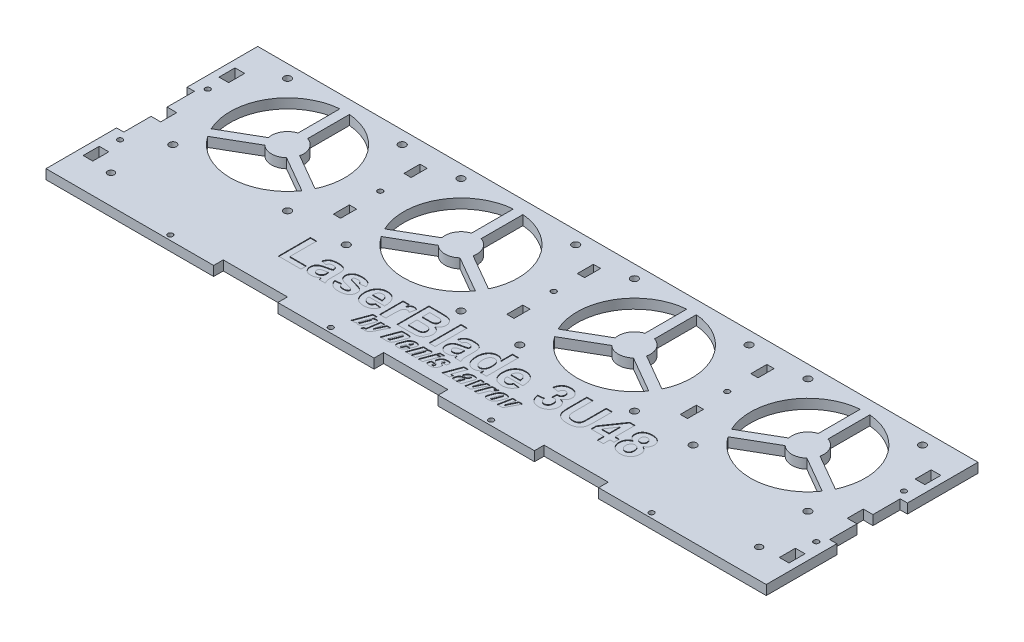
from build123d import *

# Parameters (mm, degrees)
SKETCH1_W           = 449
SKETCH1_H           = 132
BOSS_EXTRUDE1_DEPTH = 6
SKETCH4_W           = 6
SKETCH4_H           = 10
CUT_EXTRUDE2_DEPTH  = 235.077444449
CUT_EXTRUDE3_REACH  = 236.077
SKETCH5_R           = 1.6
CUT_EXTRUDE4_REACH  = 236.077
SKETCH6_R           = 2.25
LPATTERN1_COUNT     = 4
LPATTERN1_PITCH     = 108.125
CUT_EXTRUDE5_REACH  = 236.077
SKETCH7_R           = 1.6
SKETCH7_W           = 4.5
SKETCH7_H           = 10
CUT_EXTRUDE6_REACH  = 236.077
LPATTERN2_COUNT     = 4
LPATTERN2_PITCH     = 108.125
LPATTERN3_COUNT     = 3
LPATTERN3_PITCH     = 108.125
SKETCH10_W          = 3.846153847
SKETCH10_H          = 20
CUT_EXTRUDE8_DEPTH  = 0.4
CUT_EXTRUDE9_REACH  = 236.077
SKETCH11_R          = 1.6
CUT_EXTRUDE10_REACH = 236.077
SKETCH12_W          = 40
SKETCH12_H          = 6
SKETCH13_R          = 2.1
CUT_EXTRUDE11_DEPTH = 235.077444574
SKETCH14_W          = 4.5
SKETCH14_H          = 44
CUT_EXTRUDE12_DEPTH = 235.077444574


with BuildPart() as part:
    # Sketch1 → Boss-Extrude1 (new body)
    with BuildSketch(Plane(origin=(0, 0, 0), x_dir=(1, 0, 0), z_dir=(0, 1, 0))):
        Rectangle(SKETCH1_W, SKETCH1_H)
    extrude(amount=BOSS_EXTRUDE1_DEPTH)

    # Sketch4 → Cut-Extrude2 (cut, through all)
    with BuildSketch(Plane(origin=(0, 6, 0), x_dir=(1, 0, 0), z_dir=(0, 1, 0))):
        with Locations((-217, 42.332128782)):
            Rectangle(SKETCH4_W, SKETCH4_H)
        with Locations((-217, 0)):
            Rectangle(SKETCH4_W, SKETCH4_H)
        with Locations((-217, -42.332128782)):
            Rectangle(SKETCH4_W, SKETCH4_H)
    cut_extrude2 = extrude(amount=-CUT_EXTRUDE2_DEPTH, mode=Mode.SUBTRACT)

    # Sketch5 → Cut-Extrude3 (cut, up to next)
    with BuildSketch(Plane(origin=(0, 6, 0), x_dir=(1, 0, 0), z_dir=(0, 1, 0)), mode=Mode.PRIVATE) as cut_extrude3_sk1:
        with Locations((-217, -27.332128782)):
            Circle(SKETCH5_R)
    cut_extrude3_tool1 = extrude(cut_extrude3_sk1.sketch, amount=-CUT_EXTRUDE3_REACH, mode=Mode.PRIVATE) & part.part
    # Sketch5 → Cut-Extrude3 (cut, up to next)
    with BuildSketch(Plane(origin=(0, 6, 0), x_dir=(1, 0, 0), z_dir=(0, 1, 0)), mode=Mode.PRIVATE) as cut_extrude3_sk2:
        with Locations((-217, 27.332128782)):
            Circle(SKETCH5_R)
    cut_extrude3_tool2 = extrude(cut_extrude3_sk2.sketch, amount=-CUT_EXTRUDE3_REACH, mode=Mode.PRIVATE) & part.part
    cut_extrude3_1 = cut_extrude3_tool1.solids().sort_by_distance((-217, 6, 27.332129))[0]
    add(cut_extrude3_1, mode=Mode.SUBTRACT)
    cut_extrude3_2 = cut_extrude3_tool2.solids().sort_by_distance((-217, 6, -27.332129))[0]
    add(cut_extrude3_2, mode=Mode.SUBTRACT)
    cut_extrude3 = cut_extrude3_1 + cut_extrude3_2  # Cut-Extrude3 as one shape, for the pattern or mirror that repeats it

    # Mirror1: Cut-Extrude2, Cut-Extrude3 across plane
    add(cut_extrude2.mirror(Plane(origin=(0, 0, 0), x_dir=(0, 0, 1), z_dir=(1, 0, 0))), mode=Mode.SUBTRACT)
    add(cut_extrude3.mirror(Plane(origin=(0, 0, 0), x_dir=(0, 0, 1), z_dir=(1, 0, 0))), mode=Mode.SUBTRACT)

    # Sketch6 → Cut-Extrude4 (cut, up to next)
    with BuildSketch(Plane(origin=(0, 6, 0), x_dir=(1, 0, 0), z_dir=(0, 1, 0)), mode=Mode.PRIVATE) as cut_extrude4_sk1:
        with Locations((-197.9375, 58)):
            Circle(SKETCH6_R)
    cut_extrude4_tool1 = extrude(cut_extrude4_sk1.sketch, amount=-CUT_EXTRUDE4_REACH, mode=Mode.PRIVATE) & part.part
    # Sketch6 → Cut-Extrude4 (cut, up to next)
    with BuildSketch(Plane(origin=(0, 6, 0), x_dir=(1, 0, 0), z_dir=(0, 1, 0)), mode=Mode.PRIVATE) as cut_extrude4_sk2:
        with Locations((-126.4375, 58)):
            Circle(SKETCH6_R)
    cut_extrude4_tool2 = extrude(cut_extrude4_sk2.sketch, amount=-CUT_EXTRUDE4_REACH, mode=Mode.PRIVATE) & part.part
    # Sketch6 → Cut-Extrude4 (cut, up to next)
    with BuildSketch(Plane(origin=(0, 6, 0), x_dir=(1, 0, 0), z_dir=(0, 1, 0)), mode=Mode.PRIVATE) as cut_extrude4_sk3:
        with Locations((-126.4375, -13.5)):
            Circle(SKETCH6_R)
    cut_extrude4_tool3 = extrude(cut_extrude4_sk3.sketch, amount=-CUT_EXTRUDE4_REACH, mode=Mode.PRIVATE) & part.part
    # Sketch6 → Cut-Extrude4 (cut, up to next)
    with BuildSketch(Plane(origin=(0, 6, 0), x_dir=(1, 0, 0), z_dir=(0, 1, 0)), mode=Mode.PRIVATE) as cut_extrude4_sk4:
        with Locations((-197.9375, -13.5)):
            Circle(SKETCH6_R)
    cut_extrude4_tool4 = extrude(cut_extrude4_sk4.sketch, amount=-CUT_EXTRUDE4_REACH, mode=Mode.PRIVATE) & part.part
    cut_extrude4_1 = cut_extrude4_tool1.solids().sort_by_distance((-197.9375, 6, -58))[0]
    add(cut_extrude4_1, mode=Mode.SUBTRACT)
    cut_extrude4_2 = cut_extrude4_tool2.solids().sort_by_distance((-126.4375, 6, -58))[0]
    add(cut_extrude4_2, mode=Mode.SUBTRACT)
    cut_extrude4_3 = cut_extrude4_tool3.solids().sort_by_distance((-126.4375, 6, 13.5))[0]
    add(cut_extrude4_3, mode=Mode.SUBTRACT)
    cut_extrude4_4 = cut_extrude4_tool4.solids().sort_by_distance((-197.9375, 6, 13.5))[0]
    add(cut_extrude4_4, mode=Mode.SUBTRACT)
    cut_extrude4 = cut_extrude4_1 + cut_extrude4_2 + cut_extrude4_3 + cut_extrude4_4  # Cut-Extrude4 as one shape, for the pattern or mirror that repeats it

    # LPattern1: Cut-Extrude4 ×4
    with Locations(*[(i * LPATTERN1_PITCH, 0, 0) for i in range(1, LPATTERN1_COUNT)]):
        add(cut_extrude4, mode=Mode.SUBTRACT)

    # Sketch7 → Cut-Extrude5 (cut, up to next)
    with BuildSketch(Plane(origin=(0, 6, 0), x_dir=(1, 0, 0), z_dir=(0, 1, 0)), mode=Mode.PRIVATE) as cut_extrude5_sk1:
        with Locations((-108.125, 26)):
            Circle(SKETCH7_R)
    cut_extrude5_tool1 = extrude(cut_extrude5_sk1.sketch, amount=-CUT_EXTRUDE5_REACH, mode=Mode.PRIVATE) & part.part
    # Sketch7 → Cut-Extrude5 (cut, up to next)
    with BuildSketch(Plane(origin=(0, 6, 0), x_dir=(1, 0, 0), z_dir=(0, 1, 0)), mode=Mode.PRIVATE) as cut_extrude5_sk2:
        with Locations((-108.125, 48)):
            Rectangle(SKETCH7_W, SKETCH7_H)
    cut_extrude5_tool2 = extrude(cut_extrude5_sk2.sketch, amount=-CUT_EXTRUDE5_REACH, mode=Mode.PRIVATE) & part.part
    # Sketch7 → Cut-Extrude5 (cut, up to next)
    with BuildSketch(Plane(origin=(0, 6, 0), x_dir=(1, 0, 0), z_dir=(0, 1, 0)), mode=Mode.PRIVATE) as cut_extrude5_sk3:
        with Locations((-108.125, 4)):
            Rectangle(SKETCH7_W, SKETCH7_H)
    cut_extrude5_tool3 = extrude(cut_extrude5_sk3.sketch, amount=-CUT_EXTRUDE5_REACH, mode=Mode.PRIVATE) & part.part
    cut_extrude5_1 = cut_extrude5_tool1.solids().sort_by_distance((-108.125, 6, -26))[0]
    add(cut_extrude5_1, mode=Mode.SUBTRACT)
    cut_extrude5_2 = cut_extrude5_tool2.solids().sort_by_distance((-108.125, 6, -48))[0]
    add(cut_extrude5_2, mode=Mode.SUBTRACT)
    cut_extrude5_3 = cut_extrude5_tool3.solids().sort_by_distance((-108.125, 6, -4))[0]
    add(cut_extrude5_3, mode=Mode.SUBTRACT)
    cut_extrude5 = cut_extrude5_1 + cut_extrude5_2 + cut_extrude5_3  # Cut-Extrude5 as one shape, for the pattern or mirror that repeats it

    # Sketch8 → Cut-Extrude6 (cut, up to next)
    with BuildSketch(Plane(origin=(0, 6, 0), x_dir=(1, 0, 0), z_dir=(0, 1, 0)), mode=Mode.PRIVATE) as cut_extrude6_sk1:
        with BuildLine():
            Line((-159.1875, 31.789392014), (-159.1875, 57.873903492))
            ThreePointArc((-159.1875, 57.873903492), (-131.227091815, 40.125), (-129.836294594, 7.036124465))
            Line((-129.836294594, 7.036124465), (-152.426144179, 20.078380204))
            ThreePointArc((-152.426144179, 20.078380204), (-153.527245962, 27.25), (-159.1875, 31.789392014))
        make_face()
    cut_extrude6_tool1 = extrude(cut_extrude6_sk1.sketch, amount=-CUT_EXTRUDE6_REACH, mode=Mode.PRIVATE) & part.part
    # Sketch8 → Cut-Extrude6 (cut, up to next)
    with BuildSketch(Plane(origin=(0, 6, 0), x_dir=(1, 0, 0), z_dir=(0, 1, 0)), mode=Mode.PRIVATE) as cut_extrude6_sk2:
        with BuildLine():
            Line((-165.1875, 31.789392014), (-165.1875, 57.873903492))
            ThreePointArc((-165.1875, 57.873903492), (-193.147908185, 40.125), (-194.538705406, 7.036124465))
            Line((-194.538705406, 7.036124465), (-171.948855821, 20.078380204))
            ThreePointArc((-171.948855821, 20.078380204), (-170.847754038, 27.25), (-165.1875, 31.789392014))
        make_face()
    cut_extrude6_tool2 = extrude(cut_extrude6_sk2.sketch, amount=-CUT_EXTRUDE6_REACH, mode=Mode.PRIVATE) & part.part
    # Sketch8 → Cut-Extrude6 (cut, up to next)
    with BuildSketch(Plane(origin=(0, 6, 0), x_dir=(1, 0, 0), z_dir=(0, 1, 0)), mode=Mode.PRIVATE) as cut_extrude6_sk3:
        with BuildLine():
            Line((-155.426144179, 14.882227782), (-132.836294594, 1.839972043))
            ThreePointArc((-132.836294594, 1.839972043), (-162.1875, -13.5), (-191.538705406, 1.839972043))
            Line((-191.538705406, 1.839972043), (-168.948855821, 14.882227782))
            ThreePointArc((-168.948855821, 14.882227782), (-162.1875, 12.25), (-155.426144179, 14.882227782))
        make_face()
    cut_extrude6_tool3 = extrude(cut_extrude6_sk3.sketch, amount=-CUT_EXTRUDE6_REACH, mode=Mode.PRIVATE) & part.part
    cut_extrude6_1 = cut_extrude6_tool1.solids().sort_by_distance((-143.04979, 6, -33.299162))[0]
    add(cut_extrude6_1, mode=Mode.SUBTRACT)
    cut_extrude6_2 = cut_extrude6_tool2.solids().sort_by_distance((-181.32521, 6, -33.299162))[0]
    add(cut_extrude6_2, mode=Mode.SUBTRACT)
    cut_extrude6_3 = cut_extrude6_tool3.solids().sort_by_distance((-162.1875, 6, -0.151676))[0]
    add(cut_extrude6_3, mode=Mode.SUBTRACT)
    cut_extrude6 = cut_extrude6_1 + cut_extrude6_2 + cut_extrude6_3  # Cut-Extrude6 as one shape, for the pattern or mirror that repeats it

    # LPattern2: Cut-Extrude6 ×4
    with Locations(*[(i * LPATTERN2_PITCH, 0, 0) for i in range(1, LPATTERN2_COUNT)]):
        add(cut_extrude6, mode=Mode.SUBTRACT)

    # LPattern3: Cut-Extrude5 ×3
    with Locations(*[(i * LPATTERN3_PITCH, 0, 0) for i in range(1, LPATTERN3_COUNT)]):
        add(cut_extrude5, mode=Mode.SUBTRACT)

    # Sketch10 → Cut-Extrude8 (cut)
    # profile 1 of 28: a face of its own
    with BuildSketch(Plane(origin=(0, 6, 0), x_dir=(1, 0, 0), z_dir=(0, 1, 0))):
        Polygon((-104.871794872, -40.75), (-104.871794872, -20.75), (-101.025641026, -20.75), (-101.025641026, -37.416666667), (-90.769230769, -37.416666667), (-90.769230769, -40.75), align=None)
    # profile 2 of 28: a face of its own
    with BuildSketch(Plane(origin=(0, 6, 0), x_dir=(1, 0, 0), z_dir=(0, 1, 0))):
        with BuildLine():
            Line((-85.384615385, -30.493589744), (-88.717948718, -29.980769231))
            add(Edge.make_bspline(
                [(-88.717948718, -29.980769231), (-88.667993914, -29.811818924), (-88.570208401, -29.481102138), (-88.390770411, -29.007181994), (-88.180650343, -28.569043228), (-87.948917706, -28.161451558), (-87.688432037, -27.788862754), (-87.403356683, -27.450307568), (-87.092080518, -27.146944705), (-86.753115886, -26.876425606), (-86.379941462, -26.636112937), (-85.96408612, -26.432375618), (-85.506173108, -26.260825898), (-85.00684536, -26.122960032), (-84.466940613, -26.007698833), (-83.88232635, -25.93713767), (-83.256773237, -25.886203466), (-82.825971054, -25.88092356), (-82.604166667, -25.878205128)],
                knots=[0, 0, 0, 0, 1.047140172, 2.049755565, 3.008539736, 3.933190086, 4.833981818, 5.707167246, 6.560530269, 7.413560864, 8.281243119, 9.193714071, 10.161006392, 11.183910126, 12.270717139, 13.439589873, 14.681737877, 16, 16, 16, 16], degree=3))
            add(Edge.make_bspline(
                [(-82.604166667, -25.878205128), (-82.402474369, -25.879324936), (-82.012231467, -25.881491589), (-81.446884767, -25.909897324), (-80.921357924, -25.956474849), (-80.436338522, -26.025324675), (-79.990228028, -26.107198576), (-79.58445118, -26.211023628), (-79.217799919, -26.333548759), (-78.794158233, -26.524011658), (-78.328812725, -26.791660441), (-77.843124148, -27.155080964), (-77.453455745, -27.568489818), (-77.195569459, -27.954331195), (-77.04327215, -28.304053228), (-76.935805964, -28.612178923), (-76.858590784, -28.972192309), (-76.782592807, -29.378938828), (-76.735955233, -29.83461927), (-76.693866124, -30.339345486), (-76.671071187, -30.892691735), (-76.668171227, -31.278830024), (-76.666666667, -31.479166667)],
                knots=[0, 0, 0, 0, 1.253259065, 2.424859341, 3.516580225, 4.530621704, 5.468151732, 6.333678254, 7.13150538, 7.867126506, 9.216626747, 10.459871386, 11.622324159, 12.731817101, 13.322505456, 13.989117254, 14.756090433, 15.607496751, 16.559714447, 17.600403876, 18.755039204, 20, 20, 20, 20], degree=3))
            Line((-76.666666667, -31.479166667), (-76.666666667, -35.970352564))
            add(Edge.make_bspline(
                [(-76.666666667, -35.970352564), (-76.66542081, -36.125262221), (-76.663014863, -36.424417478), (-76.658082883, -36.857356287), (-76.635750561, -37.257902448), (-76.612287482, -37.626549507), (-76.585255962, -37.964735779), (-76.550177085, -38.270900146), (-76.506281316, -38.546368139), (-76.435856577, -38.875360008), (-76.322574444, -39.274516137), (-76.137356504, -39.75296707), (-75.915172533, -40.251316702), (-75.734313619, -40.580305731), (-75.641025641, -40.75)],
                knots=[0, 0, 0, 0, 1.124218554, 2.171045354, 3.141373911, 4.034856482, 4.851737235, 5.603038048, 6.270604849, 6.87504238, 8.043824301, 9.276776929, 10.59534724, 12, 12, 12, 12], degree=3))
            Line((-75.641025641, -40.75), (-79.487179487, -40.75))
            add(Edge.make_bspline(
                [(-79.487179487, -40.75), (-79.514631716, -40.672782777), (-79.574785175, -40.503584017), (-79.65602264, -40.219961727), (-79.753380433, -39.889507371), (-79.817569218, -39.651060166), (-79.851762821, -39.524038462)],
                knots=[0, 0, 0, 0, 0.768508203, 1.683958961, 2.766236402, 4, 4, 4, 4], degree=3))
            add(Edge.make_bspline(
                [(-79.851762821, -39.524038462), (-79.866504423, -39.467962206), (-79.893187937, -39.366459566), (-79.928746266, -39.228405448), (-79.959573322, -39.122858783), (-79.979827493, -39.063255859), (-79.987980769, -39.039262821)],
                knots=[0, 0, 0, 0, 1.381357368, 2.500370598, 3.396327181, 4, 4, 4, 4], degree=3))
            add(Edge.make_bspline(
                [(-79.987980769, -39.039262821), (-80.150689799, -39.196132062), (-80.46908403, -39.503098809), (-80.988359076, -39.900651643), (-81.51887593, -40.242894622), (-82.069252919, -40.52220406), (-82.635351179, -40.740497788), (-83.22277509, -40.892720883), (-83.828384446, -40.987438538), (-84.239774201, -41.000052697), (-84.447115385, -41.006410256)],
                knots=[0, 0, 0, 0, 1.082260538, 2.117802027, 3.127898709, 4.103827344, 5.070056335, 6.029309159, 7.006768236, 8, 8, 8, 8], degree=3))
            add(Edge.make_bspline(
                [(-84.447115385, -41.006410256), (-84.627516165, -41.002234579), (-84.979865781, -40.99407886), (-85.494019839, -40.940203895), (-85.977317768, -40.838024494), (-86.431973169, -40.702130243), (-86.85908857, -40.531284683), (-87.25497363, -40.316632135), (-87.621950814, -40.062985278), (-87.9563776, -39.771272789), (-88.256111466, -39.451103479), (-88.519161694, -39.110444954), (-88.736770181, -38.744728847), (-88.916796689, -38.361005116), (-89.059233953, -37.955914363), (-89.157486069, -37.531299433), (-89.220115158, -37.085994931), (-89.227165211, -36.782534305), (-89.230769231, -36.627403846)],
                knots=[0, 0, 0, 0, 1.186431605, 2.317277787, 3.39378889, 4.430144672, 5.434756152, 6.413230964, 7.385260177, 8.362630794, 9.325691837, 10.265445477, 11.187216893, 12.118354241, 13.048828682, 14.005299944, 14.980300216, 16, 16, 16, 16], degree=3))
            add(Edge.make_bspline(
                [(-89.230769231, -36.627403846), (-89.224223436, -36.423886625), (-89.211379328, -36.024546693), (-89.099164546, -35.44438438), (-88.923441677, -34.896366392), (-88.673685214, -34.387367076), (-88.362913138, -33.921943284), (-87.989051115, -33.511125313), (-87.557487293, -33.161328441), (-87.058797535, -32.864271157), (-86.47391596, -32.614036227), (-85.790852743, -32.372972762), (-84.992976985, -32.156923182), (-84.421027176, -32.033312151), (-84.118589744, -31.967948718)],
                knots=[0, 0, 0, 0, 0.9565892, 1.877012003, 2.769038917, 3.656897043, 4.535078379, 5.39337207, 6.259743944, 7.138913465, 8.11486349, 9.247429708, 10.544487161, 12, 12, 12, 12], degree=3))
            add(Edge.make_bspline(
                [(-84.118589744, -31.967948718), (-83.910188945, -31.925542253), (-83.509024737, -31.8439113), (-82.932771531, -31.721176062), (-82.406318984, -31.597468408), (-81.931901207, -31.471796551), (-81.50450124, -31.357615435), (-81.128579793, -31.242557121), (-80.802653472, -31.126756737), (-80.60467418, -31.044550382), (-80.512820513, -31.006410256)],
                knots=[0, 0, 0, 0, 1.365613701, 2.628758346, 3.783158308, 4.837685682, 5.780080249, 6.623655076, 7.36143661, 8, 8, 8, 8], degree=3))
            Line((-80.512820513, -31.006410256), (-80.512820513, -30.641826923))
            add(Edge.make_bspline(
                [(-80.512820513, -30.641826923), (-80.517945638, -30.478379159), (-80.527463287, -30.174847372), (-80.622084514, -29.753957048), (-80.786336798, -29.407287113), (-80.984599336, -29.176233756), (-81.180760566, -29.036851611), (-81.353969238, -28.944088037), (-81.556937989, -28.870056007), (-81.786815785, -28.804439792), (-82.047553419, -28.75960167), (-82.336141011, -28.722369967), (-82.653352177, -28.70410117), (-82.873916433, -28.700561395), (-82.988782051, -28.698717949)],
                knots=[0, 0, 0, 0, 1.600506204, 2.972230995, 4.195852174, 5.327580964, 5.908906329, 6.547275261, 7.247479517, 8.022494018, 8.887774365, 9.837646189, 10.873887764, 12, 12, 12, 12], degree=3))
            add(Edge.make_bspline(
                [(-82.988782051, -28.698717949), (-83.141416158, -28.702365138), (-83.431460517, -28.709295742), (-83.840202013, -28.786840289), (-84.19985995, -28.908394899), (-84.511607511, -29.089873219), (-84.780357501, -29.336409499), (-85.01437363, -29.654325212), (-85.221686146, -30.045004616), (-85.328262515, -30.338436136), (-85.384615385, -30.493589744)],
                knots=[0, 0, 0, 0, 1.120680009, 2.129582446, 3.045508635, 3.899130849, 4.760899303, 5.707254252, 6.787697471, 8, 8, 8, 8], degree=3))
        make_face()
        with BuildLine():
            add(Edge.make_bspline(
                [(-80.512820513, -33.826923077), (-80.644825002, -33.867687281), (-80.942134281, -33.95949913), (-81.441527518, -34.094390775), (-82.043473819, -34.23653594), (-82.598568938, -34.359532083), (-83.061954429, -34.459429027), (-83.388841165, -34.541106978), (-83.683406036, -34.618989274), (-83.946089523, -34.700777825), (-84.177243193, -34.777767742), (-84.37350181, -34.860264273), (-84.541696498, -34.932501987), (-84.636034668, -34.992977902), (-84.679487179, -35.020833333)],
                knots=[0, 0, 0, 0, 1.144223484, 2.577096135, 4.283377528, 6.266557578, 7.286341447, 8.209198618, 9.057088726, 9.80932547, 10.487940513, 11.073343897, 11.57317876, 12, 12, 12, 12], degree=3))
            add(Edge.make_bspline(
                [(-84.679487179, -35.020833333), (-84.787058938, -35.105557374), (-84.993502419, -35.268153265), (-85.218549736, -35.582366342), (-85.361356407, -35.93071812), (-85.376767455, -36.177310025), (-85.384615385, -36.302884615)],
                knots=[0, 0, 0, 0, 1.075028234, 2.063111864, 3.013658082, 4, 4, 4, 4], degree=3))
            add(Edge.make_bspline(
                [(-85.384615385, -36.302884615), (-85.377693482, -36.42782865), (-85.364115648, -36.672915824), (-85.25596776, -37.026076787), (-85.074106264, -37.349626586), (-84.826413313, -37.637259669), (-84.528363742, -37.886275035), (-84.177031825, -38.056951936), (-83.789971156, -38.167160097), (-83.518430379, -38.179492513), (-83.377403846, -38.185897436)],
                knots=[0, 0, 0, 0, 0.976809721, 1.916086158, 2.861451878, 3.862738809, 4.873423621, 5.878632484, 6.898253484, 8, 8, 8, 8], degree=3))
            add(Edge.make_bspline(
                [(-83.377403846, -38.185897436), (-83.216256746, -38.178605795), (-82.891837194, -38.163926344), (-82.416033186, -38.029800326), (-81.946266775, -37.831832248), (-81.661027631, -37.636998042), (-81.514423077, -37.536858974)],
                knots=[0, 0, 0, 0, 0.962503947, 1.937702252, 2.940039444, 4, 4, 4, 4], degree=3))
            add(Edge.make_bspline(
                [(-81.514423077, -37.536858974), (-81.410885529, -37.453504659), (-81.20957341, -37.291435592), (-80.969637645, -36.995269912), (-80.771637453, -36.680220257), (-80.692726241, -36.447803038), (-80.653044872, -36.330929487)],
                knots=[0, 0, 0, 0, 1.055399509, 2.052054707, 3.020454315, 4, 4, 4, 4], degree=3))
            add(Edge.make_bspline(
                [(-80.653044872, -36.330929487), (-80.631174982, -36.235085275), (-80.579980438, -36.010726539), (-80.543861449, -35.615753042), (-80.514643453, -35.118800253), (-80.513465137, -34.752484716), (-80.512820513, -34.552083333)],
                knots=[0, 0, 0, 0, 0.659054705, 1.542760655, 2.655710416, 4, 4, 4, 4], degree=3))
            Line((-80.512820513, -34.552083333), (-80.512820513, -33.826923077))
        make_face(mode=Mode.SUBTRACT)
    # profile 3 of 28: a face of its own
    with BuildSketch(Plane(origin=(0, 6, 0), x_dir=(1, 0, 0), z_dir=(0, 1, 0))):
        with BuildLine():
            Line((-74.102564103, -36.391025641), (-70.256410256, -35.878205128))
            add(Edge.make_bspline(
                [(-70.256410256, -35.878205128), (-70.21025265, -36.057846312), (-70.121341574, -36.403880094), (-69.8961345, -36.87430818), (-69.613811513, -37.281690481), (-69.258067477, -37.616032516), (-68.831188724, -37.879244834), (-68.326836701, -38.054807161), (-67.752245174, -38.169867393), (-67.343047132, -38.180365198), (-67.127403846, -38.185897436)],
                knots=[0, 0, 0, 0, 1.039319445, 2.001988807, 2.911187514, 3.807680854, 4.723381073, 5.705509029, 6.790826147, 8, 8, 8, 8], degree=3))
            add(Edge.make_bspline(
                [(-67.127403846, -38.185897436), (-66.891710899, -38.181738715), (-66.448402794, -38.173916696), (-65.83373349, -38.06536198), (-65.299684276, -37.914569968), (-65.006404297, -37.734260106), (-64.867788462, -37.649038462)],
                knots=[0, 0, 0, 0, 1.198418162, 2.254070348, 3.174803892, 4, 4, 4, 4], degree=3))
            add(Edge.make_bspline(
                [(-64.867788462, -37.649038462), (-64.788722739, -37.584852255), (-64.634956568, -37.460023608), (-64.478915967, -37.208870147), (-64.375050884, -36.933199918), (-64.364435942, -36.736580822), (-64.358974359, -36.635416667)],
                knots=[0, 0, 0, 0, 1.030872991, 2.004830756, 2.973448591, 4, 4, 4, 4], degree=3))
            add(Edge.make_bspline(
                [(-64.358974359, -36.635416667), (-64.361592401, -36.566955408), (-64.366706077, -36.433233868), (-64.420214828, -36.242006227), (-64.510024276, -36.069171125), (-64.593328911, -35.971580875), (-64.635416667, -35.922275641)],
                knots=[0, 0, 0, 0, 1.045349703, 2.041822997, 3.010676005, 4, 4, 4, 4], degree=3))
            add(Edge.make_bspline(
                [(-64.635416667, -35.922275641), (-64.696777746, -35.875884247), (-64.839406783, -35.768051074), (-65.124741181, -35.646936736), (-65.494062415, -35.529121661), (-65.772638614, -35.462198487), (-65.925480769, -35.425480769)],
                knots=[0, 0, 0, 0, 0.66031085, 1.534841007, 2.647478808, 4, 4, 4, 4], degree=3))
            add(Edge.make_bspline(
                [(-65.925480769, -35.425480769), (-66.298443101, -35.344284388), (-67.008481828, -35.189704232), (-68.017963133, -34.943777844), (-68.919937103, -34.705732174), (-69.716660388, -34.473713239), (-70.405374702, -34.249619718), (-70.986129282, -34.023153788), (-71.464832403, -33.812063027), (-71.73473621, -33.647725336), (-71.854967949, -33.574519231)],
                knots=[0, 0, 0, 0, 1.469089687, 2.796825535, 3.998745421, 5.059265209, 5.990657066, 6.784841839, 7.458693894, 8, 8, 8, 8], degree=3))
            add(Edge.make_bspline(
                [(-71.854967949, -33.574519231), (-71.992128708, -33.474537457), (-72.259930434, -33.27932644), (-72.616640548, -32.943197924), (-72.919104272, -32.577734819), (-73.166407367, -32.18180709), (-73.355165863, -31.756362813), (-73.493191322, -31.303376668), (-73.573118625, -30.8209311), (-73.584134686, -30.489874062), (-73.58974359, -30.321314103)],
                knots=[0, 0, 0, 0, 1.056974227, 2.063706289, 3.045111424, 4.005796011, 4.963194591, 5.937303459, 6.949763919, 8, 8, 8, 8], degree=3))
            add(Edge.make_bspline(
                [(-73.58974359, -30.321314103), (-73.584838777, -30.167505588), (-73.575151058, -29.863711398), (-73.507028066, -29.418395), (-73.38945351, -28.992360993), (-73.223824035, -28.58510598), (-73.011500675, -28.196617863), (-72.751196494, -27.827805714), (-72.445269042, -27.480014514), (-72.095983676, -27.148340293), (-71.695289232, -26.847947336), (-71.242020168, -26.586238722), (-70.736688009, -26.365266556), (-70.180166002, -26.188237337), (-69.573383312, -26.046937622), (-68.915530469, -25.949473519), (-68.20627348, -25.888758594), (-67.716475748, -25.881795309), (-67.463942308, -25.878205128)],
                knots=[0, 0, 0, 0, 0.866638136, 1.711736386, 2.531524902, 3.351865931, 4.183724929, 5.020979167, 5.890357771, 6.790086018, 7.73080449, 8.705352504, 9.73310627, 10.832638366, 11.99182341, 13.240303911, 14.577136024, 16, 16, 16, 16], degree=3))
            add(Edge.make_bspline(
                [(-67.463942308, -25.878205128), (-67.22346382, -25.881060024), (-66.756690158, -25.886601436), (-66.081386342, -25.935396868), (-65.453003969, -26.011944785), (-64.874652335, -26.131270163), (-64.34009443, -26.269387001), (-63.857233618, -26.454264095), (-63.416246777, -26.657014266), (-63.028772656, -26.908255959), (-62.674312818, -27.182563847), (-62.354636467, -27.492576121), (-62.062091539, -27.831923632), (-61.788452663, -28.195262651), (-61.56048624, -28.60060625), (-61.349612402, -29.029957705), (-61.168496596, -29.492298202), (-61.073915183, -29.815703725), (-61.025641026, -29.980769231)],
                knots=[0, 0, 0, 0, 1.380550213, 2.679676202, 3.885648221, 5.011984379, 6.068504557, 7.051214125, 7.977245523, 8.849391706, 9.696088241, 10.547493682, 11.400830533, 12.26732929, 13.153751704, 14.065965736, 15.012872933, 16, 16, 16, 16], degree=3))
            Line((-61.025641026, -29.980769231), (-64.871794872, -30.493589744))
            add(Edge.make_bspline(
                [(-64.871794872, -30.493589744), (-64.909969992, -30.355726843), (-64.984078058, -30.088098273), (-65.166901651, -29.72578196), (-65.394983499, -29.413248323), (-65.672085491, -29.152214862), (-66.005312863, -28.93985916), (-66.405569924, -28.801231697), (-66.864267463, -28.710802563), (-67.191005701, -28.702897878), (-67.363782051, -28.698717949)],
                knots=[0, 0, 0, 0, 1.018425325, 1.977034519, 2.876390575, 3.766006025, 4.677889232, 5.672509542, 6.769243204, 8, 8, 8, 8], degree=3))
            add(Edge.make_bspline(
                [(-67.363782051, -28.698717949), (-67.577931676, -28.701501308), (-67.975937011, -28.706674289), (-68.521625994, -28.789082732), (-68.981428261, -28.903521366), (-69.229042446, -29.048631677), (-69.342948718, -29.115384615)],
                knots=[0, 0, 0, 0, 1.252081424, 2.327041614, 3.230413832, 4, 4, 4, 4], degree=3))
            add(Edge.make_bspline(
                [(-69.342948718, -29.115384615), (-69.404589858, -29.166056344), (-69.52287572, -29.263292523), (-69.65058087, -29.451726731), (-69.731694283, -29.660548955), (-69.739579584, -29.809078829), (-69.743589744, -29.884615385)],
                knots=[0, 0, 0, 0, 1.057832138, 2.029920023, 2.998093444, 4, 4, 4, 4], degree=3))
            add(Edge.make_bspline(
                [(-69.743589744, -29.884615385), (-69.738715941, -29.949322068), (-69.728995488, -30.078374949), (-69.657258226, -30.263642115), (-69.537474294, -30.433039539), (-69.428216583, -30.522734437), (-69.37099359, -30.569711538)],
                knots=[0, 0, 0, 0, 0.958252903, 1.911167308, 2.905987877, 4, 4, 4, 4], degree=3))
            add(Edge.make_bspline(
                [(-69.37099359, -30.569711538), (-69.317034543, -30.604576321), (-69.188118077, -30.687873651), (-68.939867183, -30.788869835), (-68.617601343, -30.905239358), (-68.217208856, -31.03117678), (-67.740866932, -31.171736436), (-67.186343044, -31.319525698), (-66.553864405, -31.47412574), (-65.864886706, -31.635982902), (-65.16416149, -31.80354466), (-64.499001677, -31.985968904), (-63.890950119, -32.183068103), (-63.33959738, -32.389133658), (-62.843829171, -32.606830712), (-62.402408324, -32.828094599), (-62.016665798, -33.062839708), (-61.793266145, -33.241091208), (-61.686698718, -33.326121795)],
                knots=[0, 0, 0, 0, 0.374473465, 0.894674728, 1.558250729, 2.377018991, 3.344303564, 4.458456515, 5.727543487, 7.146141891, 8.591136569, 9.934411183, 11.172377707, 12.322386231, 13.369924362, 14.332482298, 15.204550818, 16, 16, 16, 16], degree=3))
            add(Edge.make_bspline(
                [(-61.686698718, -33.326121795), (-61.592035705, -33.413224139), (-61.404988553, -33.585331964), (-61.169433443, -33.88416718), (-60.960617498, -34.200357845), (-60.798941655, -34.547314733), (-60.668559502, -34.915947166), (-60.576164356, -35.310742993), (-60.526075227, -35.731346835), (-60.517297184, -36.019640957), (-60.512820513, -36.166666667)],
                knots=[0, 0, 0, 0, 0.971012965, 1.9186502, 2.868006896, 3.82989672, 4.803792202, 5.820095146, 6.888280979, 8, 8, 8, 8], degree=3))
            add(Edge.make_bspline(
                [(-60.512820513, -36.166666667), (-60.518785627, -36.329848522), (-60.530536807, -36.651314187), (-60.606684348, -37.125566394), (-60.742253921, -37.579611191), (-60.92063888, -38.020326635), (-61.16139105, -38.439148632), (-61.45205246, -38.840114272), (-61.789899205, -39.227913657), (-62.182289753, -39.591772829), (-62.627668237, -39.924056962), (-63.121815657, -40.218394354), (-63.668399863, -40.462610014), (-64.264303167, -40.66258013), (-64.910778386, -40.816877755), (-65.606962917, -40.929444406), (-66.353045402, -40.991281204), (-66.866878998, -41.001268571), (-67.131410256, -41.006410256)],
                knots=[0, 0, 0, 0, 0.853005228, 1.680406763, 2.502135431, 3.325285981, 4.159928718, 5.020072903, 5.910500533, 6.844018396, 7.811498054, 8.809909951, 9.84399402, 10.934451331, 12.090792638, 13.314110396, 14.617253208, 16, 16, 16, 16], degree=3))
            add(Edge.make_bspline(
                [(-67.131410256, -41.006410256), (-67.373215062, -41.002262091), (-67.844142232, -40.994183327), (-68.53124063, -40.940295949), (-69.17852094, -40.838335501), (-69.787915525, -40.703547399), (-70.359784403, -40.532734427), (-70.89189904, -40.319074235), (-71.386756745, -40.067661089), (-71.839929978, -39.773749712), (-72.254107579, -39.44745727), (-72.632220403, -39.093751299), (-72.974812258, -38.71311407), (-73.274727751, -38.301812452), (-73.542666913, -37.866263982), (-73.769447537, -37.401753495), (-73.961104454, -36.908701491), (-74.054859092, -36.565603566), (-74.102564103, -36.391025641)],
                knots=[0, 0, 0, 0, 1.275954772, 2.484986887, 3.63311568, 4.730696379, 5.776212371, 6.778566547, 7.752400714, 8.700396387, 9.623767345, 10.531135067, 11.42942751, 12.321590653, 13.213503293, 14.124285009, 15.045583181, 16, 16, 16, 16], degree=3))
        make_face()
    # profile 4 of 28: a face of its own
    with BuildSketch(Plane(origin=(0, 6, 0), x_dir=(1, 0, 0), z_dir=(0, 1, 0))):
        with BuildLine():
            Line((-48.974358974, -36.134615385), (-45.128205128, -36.647435897))
            add(Edge.make_bspline(
                [(-45.128205128, -36.647435897), (-45.191114349, -36.820725098), (-45.314807288, -37.161448607), (-45.540795097, -37.647279291), (-45.793404984, -38.100711597), (-46.071422521, -38.524168204), (-46.37381304, -38.918201598), (-46.710575436, -39.274522988), (-47.065304217, -39.606397028), (-47.452837535, -39.898020957), (-47.863465206, -40.160287551), (-48.29925082, -40.389768046), (-48.763679451, -40.576659454), (-49.249718147, -40.733168365), (-49.759573096, -40.858093975), (-50.295324399, -40.945429256), (-50.856284702, -40.998491598), (-51.239197022, -41.003737443), (-51.434294872, -41.006410256)],
                knots=[0, 0, 0, 0, 1.071172907, 2.106154283, 3.1104349, 4.085737425, 5.048416355, 5.993087888, 6.932482331, 7.868664062, 8.80754521, 9.762367971, 10.726735429, 11.713584758, 12.728370439, 13.774815933, 14.866245336, 16, 16, 16, 16], degree=3))
            add(Edge.make_bspline(
                [(-51.434294872, -41.006410256), (-51.739167929, -40.998885422), (-52.331208208, -40.984272765), (-53.187752909, -40.866844977), (-53.98330083, -40.675657947), (-54.719384175, -40.407863283), (-55.393556355, -40.056583896), (-56.006832536, -39.629435836), (-56.56041544, -39.12549077), (-56.870699531, -38.73531329), (-57.02724359, -38.538461538)],
                knots=[0, 0, 0, 0, 1.150944905, 2.235047425, 3.25761485, 4.235688044, 5.185329112, 6.119879054, 7.051444229, 8, 8, 8, 8], degree=3))
            add(Edge.make_bspline(
                [(-57.02724359, -38.538461538), (-57.142773145, -38.37094189), (-57.375415941, -38.033606222), (-57.664599486, -37.4870038), (-57.911875599, -36.909577074), (-58.108871319, -36.299672052), (-58.272629349, -35.659606069), (-58.382807981, -34.985312806), (-58.446311591, -34.278207319), (-58.456394172, -33.796337993), (-58.461538462, -33.550480769)],
                knots=[0, 0, 0, 0, 0.92479112, 1.862259343, 2.806490716, 3.778329015, 4.774107667, 5.808532634, 6.881879269, 8, 8, 8, 8], degree=3))
            add(Edge.make_bspline(
                [(-58.461538462, -33.550480769), (-58.457307654, -33.259039251), (-58.449036879, -32.689302406), (-58.351117546, -31.861100205), (-58.212947759, -31.077923962), (-58.00222952, -30.34791004), (-57.73885991, -29.662731148), (-57.408320815, -29.03119835), (-57.027053131, -28.44182418), (-56.581264078, -27.912408405), (-56.092733746, -27.436380568), (-55.572845834, -27.016920174), (-55.017708413, -26.666559761), (-54.435590114, -26.374132788), (-53.816804929, -26.155244709), (-53.169097512, -25.994114344), (-52.48963586, -25.895988125), (-52.026231887, -25.884194966), (-51.790865385, -25.878205128)],
                knots=[0, 0, 0, 0, 1.222152375, 2.389176539, 3.494777592, 4.555389183, 5.572001132, 6.56945427, 7.540785438, 8.511469914, 9.46642023, 10.399267108, 11.30862844, 12.215760073, 13.126777173, 14.056336669, 15.012798191, 16, 16, 16, 16], degree=3))
            add(Edge.make_bspline(
                [(-51.790865385, -25.878205128), (-51.527442491, -25.883774645), (-51.0119515, -25.894673604), (-50.260367507, -25.996991998), (-49.550742896, -26.163415282), (-48.885395654, -26.402555995), (-48.259987142, -26.702426846), (-47.679168741, -27.074056219), (-47.142910636, -27.51405029), (-46.652537123, -28.02222145), (-46.208740735, -28.595228249), (-45.831000823, -29.244123537), (-45.514780317, -29.962200432), (-45.258416081, -30.751310243), (-45.068888995, -31.613104986), (-44.939206651, -32.545341917), (-44.865250941, -33.54793549), (-44.869568081, -34.239462555), (-44.871794872, -34.596153846)],
                knots=[0, 0, 0, 0, 0.994942504, 1.946998194, 2.860087576, 3.744358974, 4.613292, 5.475605888, 6.343365869, 7.228414471, 8.138836547, 9.075277299, 10.058013037, 11.098483422, 12.205225682, 13.387753975, 14.652597341, 16, 16, 16, 16], degree=3))
            Line((-44.871794872, -34.596153846), (-54.615384615, -34.596153846))
            add(Edge.make_bspline(
                [(-54.615384615, -34.596153846), (-54.609076952, -34.733817541), (-54.596793908, -35.001892911), (-54.550266806, -35.39374667), (-54.469720444, -35.760539892), (-54.364311339, -36.104497864), (-54.238969648, -36.425861944), (-54.079525098, -36.721546234), (-53.895824478, -36.995322881), (-53.683454983, -37.242727392), (-53.450927709, -37.462349848), (-53.205559077, -37.655356376), (-52.947725713, -37.824125263), (-52.670766311, -37.952484771), (-52.383888942, -38.060869898), (-52.081929247, -38.130343202), (-51.76690833, -38.17650807), (-51.551988928, -38.182724807), (-51.442307692, -38.185897436)],
                knots=[0, 0, 0, 0, 1.231756261, 2.398624542, 3.522625857, 4.583815436, 5.612473245, 6.600564899, 7.580690863, 8.554470542, 9.508734211, 10.435415665, 11.342824763, 12.255949018, 13.158633635, 14.07945191, 15.019874036, 16, 16, 16, 16], degree=3))
            add(Edge.make_bspline(
                [(-51.442307692, -38.185897436), (-51.296322779, -38.179424401), (-51.013571785, -38.166887098), (-50.606005246, -38.07904464), (-50.23620698, -37.924242856), (-49.900302093, -37.708430799), (-49.601413644, -37.421832114), (-49.350826645, -37.056790775), (-49.131731252, -36.624702973), (-49.028542381, -36.303352952), (-48.974358974, -36.134615385)],
                knots=[0, 0, 0, 0, 1.004430367, 1.945431754, 2.851730883, 3.749038912, 4.678525969, 5.68064125, 6.782128749, 8, 8, 8, 8], degree=3))
        make_face()
        with BuildLine():
            add(Edge.make_bspline(
                [(-48.717948718, -32.288461538), (-48.724568188, -32.14682105), (-48.737460068, -31.870966307), (-48.779512946, -31.468770768), (-48.851703468, -31.093895663), (-48.946655192, -30.744319275), (-49.073350325, -30.424345022), (-49.214799253, -30.124801972), (-49.388268313, -29.855017178), (-49.586979838, -29.615610493), (-49.796589551, -29.396785065), (-50.028294474, -29.214817547), (-50.262575452, -29.051970308), (-50.511550467, -28.921665024), (-50.772640215, -28.822111694), (-51.044965436, -28.748917538), (-51.329001808, -28.70969702), (-51.520993002, -28.702418108), (-51.618589744, -28.698717949)],
                knots=[0, 0, 0, 0, 1.317025077, 2.564998298, 3.752245872, 4.859831213, 5.924126069, 6.944952788, 7.932526842, 8.893486968, 9.832088588, 10.740700482, 11.624936399, 12.479435602, 13.343337491, 14.21592381, 15.09308328, 16, 16, 16, 16], degree=3))
            add(Edge.make_bspline(
                [(-51.618589744, -28.698717949), (-51.72288879, -28.702103528), (-51.92841527, -28.708774981), (-52.229813731, -28.75230498), (-52.515495331, -28.829513023), (-52.787637255, -28.934010204), (-53.045656295, -29.071622047), (-53.289558219, -29.240386), (-53.520260607, -29.438189156), (-53.65926937, -29.588046667), (-53.729967949, -29.664262821)],
                knots=[0, 0, 0, 0, 1.043516863, 2.056302107, 3.038302912, 3.998520634, 4.966791607, 5.956307719, 6.960596886, 8, 8, 8, 8], degree=3))
            add(Edge.make_bspline(
                [(-53.729967949, -29.664262821), (-53.795863773, -29.747120799), (-53.928256698, -29.913592804), (-54.096169963, -30.189610012), (-54.242434077, -30.484640082), (-54.351432628, -30.806648533), (-54.447155471, -31.145199767), (-54.503305902, -31.508384738), (-54.541131376, -31.891007413), (-54.54518887, -32.15347458), (-54.547275641, -32.288461538)],
                knots=[0, 0, 0, 0, 0.903873942, 1.815995408, 2.755131859, 3.711650387, 4.716574161, 5.757841734, 6.846857195, 8, 8, 8, 8], degree=3))
            Line((-54.547275641, -32.288461538), (-48.717948718, -32.288461538))
        make_face(mode=Mode.SUBTRACT)
    # profile 5 of 28: a face of its own
    with BuildSketch(Plane(origin=(0, 6, 0), x_dir=(1, 0, 0), z_dir=(0, 1, 0))):
        with BuildLine():
            Line((-37.948717949, -40.75), (-41.794871795, -40.75))
            Line((-41.794871795, -40.75), (-41.794871795, -26.134615385))
            Line((-41.794871795, -26.134615385), (-37.948717949, -26.134615385))
            Line((-37.948717949, -26.134615385), (-37.948717949, -28.173878205))
            add(Edge.make_bspline(
                [(-37.948717949, -28.173878205), (-37.882262957, -28.058844825), (-37.754055572, -27.836918247), (-37.564404156, -27.520433382), (-37.375672301, -27.238377777), (-37.189607647, -26.990748422), (-37.017087921, -26.768256317), (-36.841573374, -26.583456011), (-36.676677977, -26.424678099), (-36.456051462, -26.265949188), (-36.172897165, -26.111033719), (-35.817009721, -25.97178186), (-35.435865002, -25.895673335), (-35.176594229, -25.884113715), (-35.044070513, -25.878205128)],
                knots=[0, 0, 0, 0, 1.218987753, 2.351715484, 3.384890168, 4.330893419, 5.1939795, 5.965577503, 6.66790098, 7.29043559, 8.453252551, 9.620708942, 10.783848683, 12, 12, 12, 12], degree=3))
            add(Edge.make_bspline(
                [(-35.044070513, -25.878205128), (-34.85220195, -25.88897687), (-34.466838535, -25.910611654), (-33.895956697, -26.065145394), (-33.340879315, -26.326736273), (-32.997608511, -26.564721723), (-32.820512821, -26.6875)],
                knots=[0, 0, 0, 0, 0.956058025, 1.920219652, 2.927027487, 4, 4, 4, 4], degree=3))
            Line((-32.820512821, -26.6875), (-33.717948718, -30.345352564))
            add(Edge.make_bspline(
                [(-33.717948718, -30.345352564), (-33.869217072, -30.250213612), (-34.15741242, -30.068955584), (-34.607249952, -29.876391578), (-35.039916909, -29.750319936), (-35.326421067, -29.7328118), (-35.46474359, -29.724358974)],
                knots=[0, 0, 0, 0, 1.139741959, 2.17142794, 3.117176162, 4, 4, 4, 4], degree=3))
            add(Edge.make_bspline(
                [(-35.46474359, -29.724358974), (-35.589406675, -29.729684349), (-35.832092062, -29.740051416), (-36.181448934, -29.822612831), (-36.503535361, -29.955631529), (-36.799631855, -30.146848704), (-37.064431473, -30.41429467), (-37.292401886, -30.766619814), (-37.483195419, -31.207075746), (-37.629023368, -31.634605241), (-37.719952628, -32.050147539), (-37.784077297, -32.445827833), (-37.832799226, -32.919514996), (-37.877400701, -33.469773432), (-37.907297303, -34.0978193), (-37.930832921, -34.801675547), (-37.947831825, -35.582986107), (-37.948413585, -36.12926382), (-37.948717949, -36.415064103)],
                knots=[0, 0, 0, 0, 0.752818562, 1.4655346, 2.15662141, 2.850671748, 3.581264886, 4.414089304, 5.371394652, 6.476667933, 7.138571115, 7.940099809, 8.898357565, 10.015825393, 11.276710544, 12.698206094, 14.272575274, 16, 16, 16, 16], degree=3))
            Line((-37.948717949, -36.415064103), (-37.948717949, -40.75))
        make_face()
    # profile 6 of 28: a face of its own
    with BuildSketch(Plane(origin=(0, 6, 0), x_dir=(1, 0, 0), z_dir=(0, 1, 0))):
        with BuildLine():
            Line((-31.025641026, -20.75), (-22.96875, -20.75))
            add(Edge.make_bspline(
                [(-22.96875, -20.75), (-22.775108531, -20.751152159), (-22.401164683, -20.753377111), (-21.858844827, -20.759577807), (-21.355464918, -20.777787742), (-20.890241102, -20.793424507), (-20.46472065, -20.829992402), (-20.075559249, -20.858722441), (-19.723982164, -20.898247498), (-19.3098152, -20.962210776), (-18.828212176, -21.06170114), (-18.284253352, -21.245731401), (-17.768633725, -21.47565921), (-17.289103547, -21.767977234), (-16.844069925, -22.109861538), (-16.430129242, -22.498588984), (-16.066375636, -22.949867705), (-15.738821258, -23.442403517), (-15.462341953, -23.976610093), (-15.27195171, -24.551310006), (-15.150450014, -25.155966051), (-15.135723302, -25.570451302), (-15.128205128, -25.782051282)],
                knots=[0, 0, 0, 0, 1.096610875, 2.117681168, 3.071055591, 3.949137991, 4.753059115, 5.489127199, 6.15892391, 6.75575099, 7.862330316, 8.938514814, 10.001276227, 11.05313779, 12.110449801, 13.174958802, 14.260456508, 15.384725817, 16.521138801, 17.654729897, 18.802709851, 20, 20, 20, 20], degree=3))
            add(Edge.make_bspline(
                [(-15.128205128, -25.782051282), (-15.136002536, -26.012478302), (-15.151377295, -26.46682927), (-15.294482277, -27.133089808), (-15.522431886, -27.770546552), (-15.84426399, -28.368858414), (-16.238442911, -28.917915969), (-16.704690707, -29.400055121), (-17.236156742, -29.812344371), (-17.635225218, -30.017500807), (-17.836538462, -30.12099359)],
                knots=[0, 0, 0, 0, 1.023065178, 2.01725758, 3.014298905, 4.023406433, 5.026736079, 6.009055718, 6.99565244, 8, 8, 8, 8], degree=3))
            add(Edge.make_bspline(
                [(-17.836538462, -30.12099359), (-17.70095014, -30.167176319), (-17.432857148, -30.258491457), (-17.049123283, -30.426172149), (-16.689585429, -30.620630877), (-16.354424133, -30.835735723), (-16.041095635, -31.07305917), (-15.758754163, -31.340470301), (-15.491198811, -31.622755361), (-15.256305962, -31.934084223), (-15.043691885, -32.259566496), (-14.863214311, -32.604296653), (-14.706935759, -32.959983038), (-14.576237114, -33.330225435), (-14.483071794, -33.717507047), (-14.408421938, -34.116949131), (-14.370233155, -34.531320087), (-14.3627581, -34.811103122), (-14.358974359, -34.952724359)],
                knots=[0, 0, 0, 0, 1.072651974, 2.1209089, 3.132484228, 4.131466326, 5.101889999, 6.071643115, 7.041396231, 8.011819904, 8.988565287, 9.95070344, 10.922775742, 11.897213062, 12.887138018, 13.903598663, 14.938838629, 16, 16, 16, 16], degree=3))
            add(Edge.make_bspline(
                [(-14.358974359, -34.952724359), (-14.367021921, -35.178883752), (-14.383079897, -35.630158537), (-14.50307912, -36.30336429), (-14.705746186, -36.964713688), (-14.980199225, -37.609916336), (-15.321100174, -38.218290153), (-15.721881248, -38.773734356), (-16.189487267, -39.257024309), (-16.707320481, -39.682873144), (-17.290840511, -40.035415257), (-17.939548808, -40.306217069), (-18.649345964, -40.510802517), (-19.149394699, -40.578764011), (-19.407051282, -40.613782051)],
                knots=[0, 0, 0, 0, 0.975059807, 1.945618526, 2.93861228, 3.952760547, 4.963632603, 5.940527786, 6.897802811, 7.855787948, 8.824773195, 9.82606706, 10.879852914, 12, 12, 12, 12], degree=3))
            add(Edge.make_bspline(
                [(-19.407051282, -40.613782051), (-19.505851007, -40.622116341), (-19.732653378, -40.641248345), (-20.117297586, -40.665034623), (-20.590236712, -40.6830144), (-21.151060094, -40.704273209), (-21.801494203, -40.719622693), (-22.540060782, -40.730104315), (-23.368020022, -40.743707392), (-23.94897923, -40.747829854), (-24.254807692, -40.75)],
                knots=[0, 0, 0, 0, 0.490565993, 1.126131979, 1.906526787, 2.832178623, 3.902933831, 5.125497984, 6.486805064, 8, 8, 8, 8], degree=3))
            Line((-24.254807692, -40.75), (-31.025641026, -40.75))
            Line((-31.025641026, -40.75), (-31.025641026, -20.75))
        make_face()
        with BuildLine():
            Line((-27.179487179, -24.083333333), (-27.179487179, -28.698717949))
            Line((-27.179487179, -28.698717949), (-24.395032051, -28.698717949))
            add(Edge.make_bspline(
                [(-24.395032051, -28.698717949), (-24.198716208, -28.699150454), (-23.824776248, -28.699974283), (-23.293270692, -28.694453656), (-22.819147477, -28.691876384), (-22.403769723, -28.684312481), (-22.047222709, -28.671829238), (-21.750791126, -28.659363709), (-21.512762011, -28.649925861), (-21.374163182, -28.63644904), (-21.314102564, -28.630608974)],
                knots=[0, 0, 0, 0, 1.528479216, 2.911428072, 4.138414629, 5.21998762, 6.145918986, 6.915989543, 7.530253335, 8, 8, 8, 8], degree=3))
            add(Edge.make_bspline(
                [(-21.314102564, -28.630608974), (-21.14089714, -28.604545499), (-20.808006941, -28.5544531), (-20.342180365, -28.407670583), (-19.938137512, -28.195376787), (-19.591393374, -27.931127056), (-19.316150869, -27.606923594), (-19.114165421, -27.233972256), (-18.99598908, -26.8107059), (-18.981748886, -26.513308159), (-18.974358974, -26.358974359)],
                knots=[0, 0, 0, 0, 1.162079002, 2.233444551, 3.225172046, 4.179556897, 5.110707885, 6.027301426, 6.976273101, 8, 8, 8, 8], degree=3))
            add(Edge.make_bspline(
                [(-18.974358974, -26.358974359), (-18.978997887, -26.209943969), (-18.987903445, -25.923842667), (-19.098531108, -25.518762895), (-19.26485148, -25.154968802), (-19.507967545, -24.841397929), (-19.81304067, -24.576583923), (-20.186434259, -24.3697278), (-20.626355277, -24.227391191), (-20.943233092, -24.177607363), (-21.109775641, -24.151442308)],
                knots=[0, 0, 0, 0, 1.044241546, 2.004684189, 2.928111627, 3.838334562, 4.769594837, 5.748424953, 6.81663206, 8, 8, 8, 8], degree=3))
            add(Edge.make_bspline(
                [(-21.109775641, -24.151442308), (-21.175180398, -24.145584553), (-21.32980896, -24.131735771), (-21.598555317, -24.122733055), (-21.940384856, -24.110062318), (-22.35703997, -24.09769633), (-22.848531931, -24.090146201), (-23.413462917, -24.087601551), (-24.051807699, -24.082056816), (-24.501868158, -24.082892132), (-24.739583333, -24.083333333)],
                knots=[0, 0, 0, 0, 0.433943041, 1.02591908, 1.776648879, 2.694999143, 3.780816848, 5.02540149, 6.428861738, 8, 8, 8, 8], degree=3))
            Line((-24.739583333, -24.083333333), (-27.179487179, -24.083333333))
        make_face(mode=Mode.SUBTRACT)
        with BuildLine():
            Line((-27.179487179, -32.032051282), (-27.179487179, -37.416666667))
            Line((-27.179487179, -37.416666667), (-23.253205128, -37.416666667))
            add(Edge.make_bspline(
                [(-23.253205128, -37.416666667), (-23.07023666, -37.417574285), (-22.722975516, -37.419296879), (-22.227585596, -37.407759161), (-21.785350817, -37.403954754), (-21.394201329, -37.384974348), (-21.056192547, -37.370615866), (-20.769933667, -37.352715609), (-20.537659794, -37.324249031), (-20.400589367, -37.302148997), (-20.340544872, -37.292467949)],
                knots=[0, 0, 0, 0, 1.504773752, 2.85595359, 4.075347731, 5.141676974, 6.076328919, 6.858106537, 7.499786952, 8, 8, 8, 8], degree=3))
            add(Edge.make_bspline(
                [(-20.340544872, -37.292467949), (-20.188062632, -37.260295224), (-19.891801521, -37.197786127), (-19.481187445, -37.018415824), (-19.1111122, -36.790941721), (-18.790598424, -36.498589839), (-18.527152716, -36.148360323), (-18.336926182, -35.739481755), (-18.222206777, -35.27676478), (-18.210988312, -34.950747802), (-18.205128205, -34.780448718)],
                knots=[0, 0, 0, 0, 1.031056579, 2.003262591, 2.954260215, 3.900917722, 4.862741126, 5.841340256, 6.872396835, 8, 8, 8, 8], degree=3))
            add(Edge.make_bspline(
                [(-18.205128205, -34.780448718), (-18.20985746, -34.634402593), (-18.219062403, -34.350140862), (-18.309166479, -33.942990503), (-18.454924538, -33.570721813), (-18.657910852, -33.235875175), (-18.911517407, -32.934245215), (-19.225026127, -32.68182313), (-19.586979222, -32.471516073), (-19.932027137, -32.332968149), (-20.259221994, -32.244081403), (-20.571297203, -32.185769957), (-20.94741161, -32.139612024), (-21.385741819, -32.100567526), (-21.888066547, -32.069344217), (-22.453035775, -32.044729816), (-23.082226088, -32.034427718), (-23.522968676, -32.032868582), (-23.75400641, -32.032051282)],
                knots=[0, 0, 0, 0, 0.992165387, 1.931134082, 2.820086661, 3.700270762, 4.583075858, 5.486803518, 6.423132184, 7.421722103, 8.005700193, 8.727213115, 9.57900282, 10.582332745, 11.720121093, 13.002085041, 14.428489784, 16, 16, 16, 16], degree=3))
            Line((-23.75400641, -32.032051282), (-27.179487179, -32.032051282))
        make_face(mode=Mode.SUBTRACT)
    # profile 7 of 28: a face of its own
    with BuildSketch(Plane(origin=(0, 6, 0), x_dir=(1, 0, 0), z_dir=(0, 1, 0))):
        with Locations((-9.102564103, -30.75)):
            Rectangle(SKETCH10_W, SKETCH10_H)
    # profile 8 of 28: a face of its own
    with BuildSketch(Plane(origin=(0, 6, 0), x_dir=(1, 0, 0), z_dir=(0, 1, 0))):
        with BuildLine():
            Line((-0.769230769, -30.493589744), (-4.102564103, -29.980769231))
            add(Edge.make_bspline(
                [(-4.102564103, -29.980769231), (-4.052609298, -29.811818924), (-3.954823786, -29.481102138), (-3.775385796, -29.007181994), (-3.565265728, -28.569043228), (-3.333533091, -28.161451558), (-3.073047421, -27.788862754), (-2.787972068, -27.450307568), (-2.476695903, -27.146944705), (-2.137731271, -26.876425606), (-1.764556847, -26.636112937), (-1.348701505, -26.432375618), (-0.890788492, -26.260825898), (-0.391460744, -26.122960032), (0.148444002, -26.007698833), (0.733058266, -25.93713767), (1.358611379, -25.886203466), (1.789413561, -25.88092356), (2.011217949, -25.878205128)],
                knots=[0, 0, 0, 0, 1.047140172, 2.049755565, 3.008539736, 3.933190086, 4.833981818, 5.707167246, 6.560530269, 7.413560864, 8.281243119, 9.193714071, 10.161006392, 11.183910126, 12.270717139, 13.439589873, 14.681737877, 16, 16, 16, 16], degree=3))
            add(Edge.make_bspline(
                [(2.011217949, -25.878205128), (2.212910247, -25.879324936), (2.603153148, -25.881491589), (3.168499849, -25.909897324), (3.694026691, -25.956474849), (4.179046093, -26.025324675), (4.625156587, -26.107198576), (5.030933436, -26.211023628), (5.397584696, -26.333548759), (5.821226382, -26.524011658), (6.28657189, -26.791660441), (6.772260467, -27.155080964), (7.16192887, -27.568489818), (7.419815156, -27.954331195), (7.572112465, -28.304053228), (7.679578651, -28.612178923), (7.756793831, -28.972192309), (7.832791808, -29.378938828), (7.879429382, -29.83461927), (7.921518491, -30.339345486), (7.944313428, -30.892691735), (7.947213389, -31.278830024), (7.948717949, -31.479166667)],
                knots=[0, 0, 0, 0, 1.253259065, 2.424859341, 3.516580225, 4.530621704, 5.468151732, 6.333678254, 7.13150538, 7.867126506, 9.216626747, 10.459871386, 11.622324159, 12.731817101, 13.322505456, 13.989117254, 14.756090433, 15.607496751, 16.559714447, 17.600403876, 18.755039204, 20, 20, 20, 20], degree=3))
            Line((7.948717949, -31.479166667), (7.948717949, -35.970352564))
            add(Edge.make_bspline(
                [(7.948717949, -35.970352564), (7.949963805, -36.125262221), (7.952369753, -36.424417478), (7.957301732, -36.857356287), (7.979634054, -37.257902448), (8.003097134, -37.626549507), (8.030128653, -37.964735779), (8.065207531, -38.270900146), (8.1091033, -38.546368139), (8.179528039, -38.875360008), (8.292810172, -39.274516137), (8.478028112, -39.75296707), (8.700212083, -40.251316702), (8.881070997, -40.580305731), (8.974358974, -40.75)],
                knots=[0, 0, 0, 0, 1.124218554, 2.171045354, 3.141373911, 4.034856482, 4.851737235, 5.603038048, 6.270604849, 6.87504238, 8.043824301, 9.276776929, 10.59534724, 12, 12, 12, 12], degree=3))
            Line((8.974358974, -40.75), (5.128205128, -40.75))
            add(Edge.make_bspline(
                [(5.128205128, -40.75), (5.100752899, -40.672782777), (5.04059944, -40.503584017), (4.959361976, -40.219961727), (4.862004182, -39.889507371), (4.797815397, -39.651060166), (4.763621795, -39.524038462)],
                knots=[0, 0, 0, 0, 0.768508203, 1.683958961, 2.766236402, 4, 4, 4, 4], degree=3))
            add(Edge.make_bspline(
                [(4.763621795, -39.524038462), (4.748880192, -39.467962206), (4.722196678, -39.366459566), (4.686638349, -39.228405448), (4.655811293, -39.122858783), (4.635557122, -39.063255859), (4.627403846, -39.039262821)],
                knots=[0, 0, 0, 0, 1.381357368, 2.500370598, 3.396327181, 4, 4, 4, 4], degree=3))
            add(Edge.make_bspline(
                [(4.627403846, -39.039262821), (4.464694817, -39.196132062), (4.146300585, -39.503098809), (3.62702554, -39.900651643), (3.096508685, -40.242894622), (2.546131697, -40.52220406), (1.980033437, -40.740497788), (1.392609525, -40.892720883), (0.78700017, -40.987438538), (0.375610415, -41.000052697), (0.168269231, -41.006410256)],
                knots=[0, 0, 0, 0, 1.082260538, 2.117802027, 3.127898709, 4.103827344, 5.070056335, 6.029309159, 7.006768236, 8, 8, 8, 8], degree=3))
            add(Edge.make_bspline(
                [(0.168269231, -41.006410256), (-0.012131549, -41.002234579), (-0.364481166, -40.99407886), (-0.878635224, -40.940203895), (-1.361933153, -40.838024494), (-1.816588553, -40.702130243), (-2.243703954, -40.531284683), (-2.639589014, -40.316632135), (-3.006566199, -40.062985278), (-3.340992984, -39.771272789), (-3.640726851, -39.451103479), (-3.903777079, -39.110444954), (-4.121385566, -38.744728847), (-4.301412074, -38.361005116), (-4.443849338, -37.955914363), (-4.542101454, -37.531299433), (-4.604730542, -37.085994931), (-4.611780596, -36.782534305), (-4.615384615, -36.627403846)],
                knots=[0, 0, 0, 0, 1.186431605, 2.317277787, 3.39378889, 4.430144672, 5.434756152, 6.413230964, 7.385260177, 8.362630794, 9.325691837, 10.265445477, 11.187216893, 12.118354241, 13.048828682, 14.005299944, 14.980300216, 16, 16, 16, 16], degree=3))
            add(Edge.make_bspline(
                [(-4.615384615, -36.627403846), (-4.608838821, -36.423886625), (-4.595994712, -36.024546693), (-4.48377993, -35.44438438), (-4.308057061, -34.896366392), (-4.058300598, -34.387367076), (-3.747528523, -33.921943284), (-3.373666499, -33.511125313), (-2.942102677, -33.161328441), (-2.443412919, -32.864271157), (-1.858531345, -32.614036227), (-1.175468128, -32.372972762), (-0.37759237, -32.156923182), (0.19435744, -32.033312151), (0.496794872, -31.967948718)],
                knots=[0, 0, 0, 0, 0.9565892, 1.877012003, 2.769038917, 3.656897043, 4.535078379, 5.39337207, 6.259743944, 7.138913465, 8.11486349, 9.247429708, 10.544487161, 12, 12, 12, 12], degree=3))
            add(Edge.make_bspline(
                [(0.496794872, -31.967948718), (0.705195671, -31.925542253), (1.106359879, -31.8439113), (1.682613084, -31.721176062), (2.209065632, -31.597468408), (2.683483409, -31.471796551), (3.110883375, -31.357615435), (3.486804823, -31.242557121), (3.812731143, -31.126756737), (4.010710436, -31.044550382), (4.102564103, -31.006410256)],
                knots=[0, 0, 0, 0, 1.365613701, 2.628758346, 3.783158308, 4.837685682, 5.780080249, 6.623655076, 7.36143661, 8, 8, 8, 8], degree=3))
            Line((4.102564103, -31.006410256), (4.102564103, -30.641826923))
            add(Edge.make_bspline(
                [(4.102564103, -30.641826923), (4.097438977, -30.478379159), (4.087921328, -30.174847372), (3.993300101, -29.753957048), (3.829047818, -29.407287113), (3.630785279, -29.176233756), (3.434624049, -29.036851611), (3.261415377, -28.944088037), (3.058446627, -28.870056007), (2.828568831, -28.804439792), (2.567831196, -28.75960167), (2.279243604, -28.722369967), (1.962032438, -28.70410117), (1.741468182, -28.700561395), (1.626602564, -28.698717949)],
                knots=[0, 0, 0, 0, 1.600506204, 2.972230995, 4.195852174, 5.327580964, 5.908906329, 6.547275261, 7.247479517, 8.022494018, 8.887774365, 9.837646189, 10.873887764, 12, 12, 12, 12], degree=3))
            add(Edge.make_bspline(
                [(1.626602564, -28.698717949), (1.473968457, -28.702365138), (1.183924099, -28.709295742), (0.775182602, -28.786840289), (0.415524666, -28.908394899), (0.103777104, -29.089873219), (-0.164972885, -29.336409499), (-0.398989015, -29.654325212), (-0.606301531, -30.045004616), (-0.7128779, -30.338436136), (-0.769230769, -30.493589744)],
                knots=[0, 0, 0, 0, 1.120680009, 2.129582446, 3.045508635, 3.899130849, 4.760899303, 5.707254252, 6.787697471, 8, 8, 8, 8], degree=3))
        make_face()
        with BuildLine():
            add(Edge.make_bspline(
                [(4.102564103, -33.826923077), (3.970559613, -33.867687281), (3.673250335, -33.95949913), (3.173857098, -34.094390775), (2.571910796, -34.23653594), (2.016815677, -34.359532083), (1.553430186, -34.459429027), (1.226543451, -34.541106978), (0.931978579, -34.618989274), (0.669295092, -34.700777825), (0.438141423, -34.777767742), (0.241882806, -34.860264273), (0.073688118, -34.932501987), (-0.020650053, -34.992977902), (-0.064102564, -35.020833333)],
                knots=[0, 0, 0, 0, 1.144223484, 2.577096135, 4.283377528, 6.266557578, 7.286341447, 8.209198618, 9.057088726, 9.80932547, 10.487940513, 11.073343897, 11.57317876, 12, 12, 12, 12], degree=3))
            add(Edge.make_bspline(
                [(-0.064102564, -35.020833333), (-0.171674322, -35.105557374), (-0.378117803, -35.268153265), (-0.60316512, -35.582366342), (-0.745971791, -35.93071812), (-0.761382839, -36.177310025), (-0.769230769, -36.302884615)],
                knots=[0, 0, 0, 0, 1.075028234, 2.063111864, 3.013658082, 4, 4, 4, 4], degree=3))
            add(Edge.make_bspline(
                [(-0.769230769, -36.302884615), (-0.762308867, -36.42782865), (-0.748731032, -36.672915824), (-0.640583145, -37.026076787), (-0.458721649, -37.349626586), (-0.211028698, -37.637259669), (0.087020874, -37.886275035), (0.43835279, -38.056951936), (0.825413459, -38.167160097), (1.096954237, -38.179492513), (1.237980769, -38.185897436)],
                knots=[0, 0, 0, 0, 0.976809721, 1.916086158, 2.861451878, 3.862738809, 4.873423621, 5.878632484, 6.898253484, 8, 8, 8, 8], degree=3))
            add(Edge.make_bspline(
                [(1.237980769, -38.185897436), (1.39912787, -38.178605795), (1.723547421, -38.163926344), (2.19935143, -38.029800326), (2.669117841, -37.831832248), (2.954356985, -37.636998042), (3.100961538, -37.536858974)],
                knots=[0, 0, 0, 0, 0.962503947, 1.937702252, 2.940039444, 4, 4, 4, 4], degree=3))
            add(Edge.make_bspline(
                [(3.100961538, -37.536858974), (3.204499086, -37.453504659), (3.405811205, -37.291435592), (3.645746971, -36.995269912), (3.843747163, -36.680220257), (3.922658374, -36.447803038), (3.962339744, -36.330929487)],
                knots=[0, 0, 0, 0, 1.055399509, 2.052054707, 3.020454315, 4, 4, 4, 4], degree=3))
            add(Edge.make_bspline(
                [(3.962339744, -36.330929487), (3.984209633, -36.235085275), (4.035404178, -36.010726539), (4.071523167, -35.615753042), (4.100741163, -35.118800253), (4.101919478, -34.752484716), (4.102564103, -34.552083333)],
                knots=[0, 0, 0, 0, 0.659054705, 1.542760655, 2.655710416, 4, 4, 4, 4], degree=3))
            Line((4.102564103, -34.552083333), (4.102564103, -33.826923077))
        make_face(mode=Mode.SUBTRACT)
    # profile 9 of 28: a face of its own
    with BuildSketch(Plane(origin=(0, 6, 0), x_dir=(1, 0, 0), z_dir=(0, 1, 0))):
        with BuildLine():
            Line((24.871794872, -40.75), (21.025641026, -40.75))
            Line((21.025641026, -40.75), (21.025641026, -38.638621795))
            add(Edge.make_bspline(
                [(21.025641026, -38.638621795), (20.885252557, -38.835213758), (20.612385676, -39.217320897), (20.125658624, -39.706988722), (19.614537616, -40.128706569), (19.05746991, -40.448740675), (18.48830958, -40.698281748), (17.911797583, -40.876177498), (17.330457843, -40.984409093), (16.940881896, -40.99909415), (16.746794872, -41.006410256)],
                knots=[0, 0, 0, 0, 1.136300101, 2.208576455, 3.242281452, 4.249058783, 5.223933999, 6.165280663, 7.085941471, 8, 8, 8, 8], degree=3))
            add(Edge.make_bspline(
                [(16.746794872, -41.006410256), (16.554159925, -40.999944026), (16.173340559, -40.987160958), (15.611454336, -40.894406806), (15.072171109, -40.731277545), (14.552892696, -40.510693777), (14.055526098, -40.227031904), (13.580582011, -39.879512209), (13.12711712, -39.467300971), (12.695601569, -38.998023119), (12.304398975, -38.468557376), (11.957424957, -37.890499273), (11.668705773, -37.259610442), (11.433173664, -36.580439808), (11.24927229, -35.851142488), (11.117727026, -35.072921843), (11.042925767, -34.245056192), (11.031503288, -33.677500026), (11.025641026, -33.386217949)],
                knots=[0, 0, 0, 0, 0.868680302, 1.717291116, 2.559594063, 3.404262612, 4.256691068, 5.136162843, 6.05305749, 7.01654586, 8.006773995, 9.017023416, 10.051895049, 11.130067211, 12.254925639, 13.440213999, 14.686262564, 16, 16, 16, 16], degree=3))
            add(Edge.make_bspline(
                [(11.025641026, -33.386217949), (11.031469557, -33.088261865), (11.042780529, -32.510041953), (11.11718893, -31.670110197), (11.248883547, -30.886498638), (11.432679288, -30.157129346), (11.667786042, -29.481564751), (11.956646657, -28.860732714), (12.29778229, -28.295210068), (12.692715459, -27.790287256), (13.125085157, -27.340367926), (13.591047019, -26.950973707), (14.08397493, -26.619603682), (14.601983963, -26.343956864), (15.151673873, -26.134972582), (15.727251336, -25.989128404), (16.329455331, -25.891009505), (16.741051916, -25.882531908), (16.951121795, -25.878205128)],
                knots=[0, 0, 0, 0, 1.327136196, 2.575468729, 3.751890053, 4.862767969, 5.921925726, 6.933145827, 7.907387355, 8.856890668, 9.782390252, 10.681851331, 11.556239068, 12.423659137, 13.289752485, 14.16837887, 15.06518071, 16, 16, 16, 16], degree=3))
            add(Edge.make_bspline(
                [(16.951121795, -25.878205128), (17.145145683, -25.884446832), (17.527407643, -25.896744111), (18.090802959, -25.992213275), (18.63357568, -26.146987862), (19.154478053, -26.372336815), (19.658506341, -26.652927558), (20.139191477, -27.000238818), (20.601145151, -27.408199835), (20.88166679, -27.718266165), (21.025641026, -27.877403846)],
                knots=[0, 0, 0, 0, 0.992399448, 1.955205421, 2.915485871, 3.87381908, 4.85285833, 5.861755538, 6.90257267, 8, 8, 8, 8], degree=3))
            Line((21.025641026, -27.877403846), (21.025641026, -20.75))
            Line((21.025641026, -20.75), (24.871794872, -20.75))
            Line((24.871794872, -20.75), (24.871794872, -40.75))
        make_face()
        with BuildLine():
            add(Edge.make_bspline(
                [(14.871794872, -33.165865385), (14.872366837, -33.359577781), (14.873468268, -33.732608842), (14.908829207, -34.270941644), (14.953201274, -34.767413048), (15.023271338, -35.221530961), (15.103146645, -35.636681563), (15.213046507, -36.007813626), (15.333542, -36.341439662), (15.438526556, -36.540248185), (15.488782051, -36.635416667)],
                knots=[0, 0, 0, 0, 1.306099746, 2.515150209, 3.637201974, 4.666415219, 5.613193253, 6.485405436, 7.274972403, 8, 8, 8, 8], degree=3))
            add(Edge.make_bspline(
                [(15.488782051, -36.635416667), (15.563051515, -36.759175207), (15.706761733, -36.998645992), (15.968964463, -37.311818711), (16.243303558, -37.585742491), (16.549739582, -37.803135146), (16.874157893, -37.978539733), (17.223618363, -38.097951959), (17.592925137, -38.173154349), (17.846846386, -38.18158432), (17.976762821, -38.185897436)],
                knots=[0, 0, 0, 0, 1.120960711, 2.169040953, 3.168100815, 4.128109154, 5.080726846, 6.026866003, 6.990464429, 8, 8, 8, 8], degree=3))
            add(Edge.make_bspline(
                [(17.976762821, -38.185897436), (18.081097283, -38.181382525), (18.287040697, -38.172470644), (18.589699489, -38.121744577), (18.878247173, -38.02643841), (19.154371368, -37.897378096), (19.422802325, -37.736682755), (19.674944328, -37.533651909), (19.915950403, -37.29563992), (20.1445704, -37.023379487), (20.35373087, -36.71457018), (20.534066878, -36.367412685), (20.685649206, -35.98282129), (20.813293006, -35.56520449), (20.909377723, -35.110580795), (20.974352948, -34.621649272), (21.021665101, -34.09626787), (21.024288114, -33.733555837), (21.025641026, -33.546474359)],
                knots=[0, 0, 0, 0, 0.808519481, 1.595918141, 2.367946092, 3.154732969, 3.953063559, 4.785064852, 5.655532678, 6.573390792, 7.534530006, 8.538576741, 9.596996712, 10.732480475, 11.917354949, 13.191565377, 14.551451138, 16, 16, 16, 16], degree=3))
            add(Edge.make_bspline(
                [(21.025641026, -33.546474359), (21.023815259, -33.339405493), (21.02028953, -32.939535773), (20.979862865, -32.361725689), (20.913515911, -31.827599805), (20.817569993, -31.339192824), (20.699147866, -30.894728792), (20.551068459, -30.495884627), (20.376712608, -30.140652098), (20.169801846, -29.833428079), (19.942301932, -29.569249182), (19.708308496, -29.332886745), (19.451327192, -29.139888676), (19.182575365, -28.977490034), (18.89562949, -28.85203596), (18.592265171, -28.765578822), (18.275603234, -28.705456631), (18.058511809, -28.70098133), (17.948717949, -28.698717949)],
                knots=[0, 0, 0, 0, 1.538844071, 2.971654591, 4.302575584, 5.536777829, 6.668535022, 7.717613974, 8.694219699, 9.60272161, 10.461894315, 11.283130947, 12.06930595, 12.843865074, 13.612870817, 14.388700961, 15.185086457, 16, 16, 16, 16], degree=3))
            add(Edge.make_bspline(
                [(17.948717949, -28.698717949), (17.841666522, -28.701436176), (17.630250308, -28.706804413), (17.320644987, -28.760254542), (17.024515053, -28.848842527), (16.743190511, -28.975028356), (16.472189142, -29.131999183), (16.2148538, -29.32510759), (15.973509963, -29.556725681), (15.746420066, -29.820545351), (15.534717337, -30.116291404), (15.361503624, -30.453198725), (15.20697241, -30.819296493), (15.084161916, -31.22225581), (14.988615602, -31.659140236), (14.922926689, -32.13068275), (14.875768125, -32.636068819), (14.873147859, -32.985457031), (14.871794872, -33.165865385)],
                knots=[0, 0, 0, 0, 0.844531552, 1.667868134, 2.47173451, 3.278912967, 4.096287191, 4.939765054, 5.812329042, 6.731790039, 7.685377109, 8.6758465, 9.71559549, 10.819442259, 11.996209133, 13.242749135, 14.576279701, 16, 16, 16, 16], degree=3))
        make_face(mode=Mode.SUBTRACT)
    # profile 10 of 28: a face of its own
    with BuildSketch(Plane(origin=(0, 6, 0), x_dir=(1, 0, 0), z_dir=(0, 1, 0))):
        with BuildLine():
            Line((37.179487179, -36.134615385), (41.025641026, -36.647435897))
            add(Edge.make_bspline(
                [(41.025641026, -36.647435897), (40.962731805, -36.820725098), (40.839038865, -37.161448607), (40.613051057, -37.647279291), (40.36044117, -38.100711597), (40.082423633, -38.524168204), (39.780033114, -38.918201598), (39.443270717, -39.274522988), (39.088541937, -39.606397028), (38.701008619, -39.898020957), (38.290380948, -40.160287551), (37.854595333, -40.389768046), (37.390166702, -40.576659454), (36.904128006, -40.733168365), (36.394273058, -40.858093975), (35.858521755, -40.945429256), (35.297561451, -40.998491598), (34.914649132, -41.003737443), (34.719551282, -41.006410256)],
                knots=[0, 0, 0, 0, 1.071172907, 2.106154283, 3.1104349, 4.085737425, 5.048416355, 5.993087888, 6.932482331, 7.868664062, 8.80754521, 9.762367971, 10.726735429, 11.713584758, 12.728370439, 13.774815933, 14.866245336, 16, 16, 16, 16], degree=3))
            add(Edge.make_bspline(
                [(34.719551282, -41.006410256), (34.414678225, -40.998885422), (33.822637946, -40.984272765), (32.966093245, -40.866844977), (32.170545324, -40.675657947), (31.434461979, -40.407863283), (30.760289799, -40.056583896), (30.147013618, -39.629435836), (29.593430713, -39.12549077), (29.283146623, -38.73531329), (29.126602564, -38.538461538)],
                knots=[0, 0, 0, 0, 1.150944905, 2.235047425, 3.25761485, 4.235688044, 5.185329112, 6.119879054, 7.051444229, 8, 8, 8, 8], degree=3))
            add(Edge.make_bspline(
                [(29.126602564, -38.538461538), (29.011073009, -38.37094189), (28.778430212, -38.033606222), (28.489246668, -37.4870038), (28.241970555, -36.909577074), (28.044974835, -36.299672052), (27.881216805, -35.659606069), (27.771038173, -34.985312806), (27.707534563, -34.278207319), (27.697451982, -33.796337993), (27.692307692, -33.550480769)],
                knots=[0, 0, 0, 0, 0.92479112, 1.862259343, 2.806490716, 3.778329015, 4.774107667, 5.808532634, 6.881879269, 8, 8, 8, 8], degree=3))
            add(Edge.make_bspline(
                [(27.692307692, -33.550480769), (27.6965385, -33.259039251), (27.704809275, -32.689302406), (27.802728608, -31.861100205), (27.940898395, -31.077923962), (28.151616634, -30.34791004), (28.414986244, -29.662731148), (28.745525339, -29.03119835), (29.126793022, -28.44182418), (29.572582076, -27.912408405), (30.061112408, -27.436380568), (30.58100032, -27.016920174), (31.136137741, -26.666559761), (31.718256039, -26.374132788), (32.337041225, -26.155244709), (32.984748642, -25.994114344), (33.664210294, -25.895988125), (34.127614267, -25.884194966), (34.362980769, -25.878205128)],
                knots=[0, 0, 0, 0, 1.222152375, 2.389176539, 3.494777592, 4.555389183, 5.572001132, 6.56945427, 7.540785438, 8.511469914, 9.46642023, 10.399267108, 11.30862844, 12.215760073, 13.126777173, 14.056336669, 15.012798191, 16, 16, 16, 16], degree=3))
            add(Edge.make_bspline(
                [(34.362980769, -25.878205128), (34.626403662, -25.883774645), (35.141894654, -25.894673604), (35.893478647, -25.996991998), (36.603103258, -26.163415282), (37.2684505, -26.402555995), (37.893859012, -26.702426846), (38.474677413, -27.074056219), (39.010935518, -27.51405029), (39.501309031, -28.02222145), (39.945105419, -28.595228249), (40.322845331, -29.244123537), (40.639065837, -29.962200432), (40.895430073, -30.751310243), (41.084957159, -31.613104986), (41.214639503, -32.545341917), (41.288595213, -33.54793549), (41.284278073, -34.239462555), (41.282051282, -34.596153846)],
                knots=[0, 0, 0, 0, 0.994942504, 1.946998194, 2.860087576, 3.744358974, 4.613292, 5.475605888, 6.343365869, 7.228414471, 8.138836547, 9.075277299, 10.058013037, 11.098483422, 12.205225682, 13.387753975, 14.652597341, 16, 16, 16, 16], degree=3))
            Line((41.282051282, -34.596153846), (31.538461538, -34.596153846))
            add(Edge.make_bspline(
                [(31.538461538, -34.596153846), (31.544769202, -34.733817541), (31.557052245, -35.001892911), (31.603579348, -35.39374667), (31.68412571, -35.760539892), (31.789534815, -36.104497864), (31.914876506, -36.425861944), (32.074321055, -36.721546234), (32.258021676, -36.995322881), (32.470391171, -37.242727392), (32.702918445, -37.462349848), (32.948287077, -37.655356376), (33.206120441, -37.824125263), (33.483079843, -37.952484771), (33.769957211, -38.060869898), (34.071916907, -38.130343202), (34.386937824, -38.17650807), (34.601857226, -38.182724807), (34.711538462, -38.185897436)],
                knots=[0, 0, 0, 0, 1.231756261, 2.398624542, 3.522625857, 4.583815436, 5.612473245, 6.600564899, 7.580690863, 8.554470542, 9.508734211, 10.435415665, 11.342824763, 12.255949018, 13.158633635, 14.07945191, 15.019874036, 16, 16, 16, 16], degree=3))
            add(Edge.make_bspline(
                [(34.711538462, -38.185897436), (34.857523374, -38.179424401), (35.140274369, -38.166887098), (35.547840908, -38.07904464), (35.917639174, -37.924242856), (36.253544061, -37.708430799), (36.55243251, -37.421832114), (36.803019508, -37.056790775), (37.022114901, -36.624702973), (37.125303772, -36.303352952), (37.179487179, -36.134615385)],
                knots=[0, 0, 0, 0, 1.004430367, 1.945431754, 2.851730883, 3.749038912, 4.678525969, 5.68064125, 6.782128749, 8, 8, 8, 8], degree=3))
        make_face()
        with BuildLine():
            add(Edge.make_bspline(
                [(37.435897436, -32.288461538), (37.429277966, -32.14682105), (37.416386086, -31.870966307), (37.374333207, -31.468770768), (37.302142686, -31.093895663), (37.207190962, -30.744319275), (37.080495828, -30.424345022), (36.939046901, -30.124801972), (36.765577841, -29.855017178), (36.566866316, -29.615610493), (36.357256603, -29.396785065), (36.12555168, -29.214817547), (35.891270702, -29.051970308), (35.642295687, -28.921665024), (35.381205939, -28.822111694), (35.108880718, -28.748917538), (34.824844346, -28.70969702), (34.632853152, -28.702418108), (34.53525641, -28.698717949)],
                knots=[0, 0, 0, 0, 1.317025077, 2.564998298, 3.752245872, 4.859831213, 5.924126069, 6.944952788, 7.932526842, 8.893486968, 9.832088588, 10.740700482, 11.624936399, 12.479435602, 13.343337491, 14.21592381, 15.09308328, 16, 16, 16, 16], degree=3))
            add(Edge.make_bspline(
                [(34.53525641, -28.698717949), (34.430957364, -28.702103528), (34.225430883, -28.708774981), (33.924032423, -28.75230498), (33.638350823, -28.829513023), (33.366208899, -28.934010204), (33.108189859, -29.071622047), (32.864287934, -29.240386), (32.633585546, -29.438189156), (32.494576784, -29.588046667), (32.423878205, -29.664262821)],
                knots=[0, 0, 0, 0, 1.043516863, 2.056302107, 3.038302912, 3.998520634, 4.966791607, 5.956307719, 6.960596886, 8, 8, 8, 8], degree=3))
            add(Edge.make_bspline(
                [(32.423878205, -29.664262821), (32.35798238, -29.747120799), (32.225589455, -29.913592804), (32.057676191, -30.189610012), (31.911412077, -30.484640082), (31.802413525, -30.806648533), (31.706690682, -31.145199767), (31.650540252, -31.508384738), (31.612714778, -31.891007413), (31.608657284, -32.15347458), (31.606570513, -32.288461538)],
                knots=[0, 0, 0, 0, 0.903873942, 1.815995408, 2.755131859, 3.711650387, 4.716574161, 5.757841734, 6.846857195, 8, 8, 8, 8], degree=3))
            Line((31.606570513, -32.288461538), (37.435897436, -32.288461538))
        make_face(mode=Mode.SUBTRACT)
    # profile 11 of 28: a face of its own
    with BuildSketch(Plane(origin=(0, 6, 0), x_dir=(1, 0, 0), z_dir=(0, 1, 0))):
        with BuildLine():
            Line((51.025641026, -35.068910256), (54.871794872, -34.596153846))
            add(Edge.make_bspline(
                [(54.871794872, -34.596153846), (54.905010401, -34.832645686), (54.968058156, -35.281540515), (55.164643573, -35.90286792), (55.421276004, -36.443556541), (55.761044467, -36.886571259), (56.153874004, -37.238909705), (56.591969754, -37.490316007), (57.071368927, -37.648857605), (57.405278159, -37.664879414), (57.576121795, -37.673076923)],
                knots=[0, 0, 0, 0, 1.26631894, 2.403651751, 3.447242243, 4.428907923, 5.348362865, 6.231623936, 7.095215805, 8, 8, 8, 8], degree=3))
            add(Edge.make_bspline(
                [(57.576121795, -37.673076923), (57.66841583, -37.671094958), (57.851235895, -37.667168993), (58.119986063, -37.625977923), (58.378212811, -37.558269609), (58.623368354, -37.460842391), (58.856623019, -37.339787747), (59.081048388, -37.195628132), (59.287216786, -37.01557877), (59.488503735, -36.818585693), (59.667128056, -36.594341657), (59.824474811, -36.351046286), (59.96259402, -36.091112707), (60.069650563, -35.807838859), (60.153451813, -35.507360837), (60.21336169, -35.188374322), (60.249822791, -34.852081724), (60.254184349, -34.621621222), (60.256410256, -34.50400641)],
                knots=[0, 0, 0, 0, 0.951760839, 1.885289532, 2.797832748, 3.70117291, 4.60103766, 5.506897018, 6.445598779, 7.420035506, 8.410036365, 9.396193293, 10.407074535, 11.440988179, 12.514285005, 13.622404236, 14.786601276, 16, 16, 16, 16], degree=3))
            add(Edge.make_bspline(
                [(60.256410256, -34.50400641), (60.248072662, -34.285720333), (60.232167793, -33.869315832), (60.109265796, -33.278550591), (59.896131777, -32.759243972), (59.597520572, -32.320712083), (59.242685488, -31.967946103), (58.845197075, -31.702778898), (58.401298563, -31.550442332), (58.092707631, -31.529711362), (57.936698718, -31.519230769)],
                knots=[0, 0, 0, 0, 1.241512862, 2.368321189, 3.414110003, 4.41529485, 5.36642979, 6.245396713, 7.112955941, 8, 8, 8, 8], degree=3))
            add(Edge.make_bspline(
                [(57.936698718, -31.519230769), (57.825630069, -31.522072815), (57.590176252, -31.528097652), (57.223940588, -31.590696401), (56.82455901, -31.677085499), (56.55261051, -31.760186084), (56.41025641, -31.803685897)],
                knots=[0, 0, 0, 0, 0.854525515, 1.811503923, 2.854410343, 4, 4, 4, 4], degree=3))
            Line((56.41025641, -31.803685897), (56.770833333, -28.698717949))
            add(Edge.make_bspline(
                [(56.770833333, -28.698717949), (56.877715389, -28.700551419), (57.085119505, -28.70410926), (57.387991733, -28.678998367), (57.671489477, -28.633151487), (57.934951245, -28.558765175), (58.17862235, -28.468519387), (58.404633892, -28.355132278), (58.607456629, -28.214027874), (58.854406458, -28.001031521), (59.107058461, -27.681869241), (59.335471856, -27.244226061), (59.462739222, -26.745220307), (59.478841479, -26.395720321), (59.487179487, -26.21474359)],
                knots=[0, 0, 0, 0, 0.916749589, 1.778948191, 2.604102396, 3.376994206, 4.124053722, 4.831292757, 5.54010828, 6.238660037, 7.62386988, 9.002523041, 10.447858069, 12, 12, 12, 12], degree=3))
            add(Edge.make_bspline(
                [(59.487179487, -26.21474359), (59.481558, -26.060636699), (59.470779204, -25.765147881), (59.374086107, -25.344680966), (59.209051091, -24.973460712), (58.978204796, -24.657930792), (58.695033837, -24.401710838), (58.364051464, -24.212382958), (57.984943783, -24.101979582), (57.718415984, -24.08970302), (57.580128205, -24.083333333)],
                knots=[0, 0, 0, 0, 1.146968804, 2.199229744, 3.192297141, 4.153502289, 5.090509175, 6.0173182, 6.971286811, 8, 8, 8, 8], degree=3))
            add(Edge.make_bspline(
                [(57.580128205, -24.083333333), (57.441491961, -24.090186542), (57.168981142, -24.103657575), (56.779037936, -24.236907453), (56.419294418, -24.443076942), (56.10184661, -24.738330822), (55.826707712, -25.105550853), (55.613494932, -25.55340372), (55.4633403, -26.074872932), (55.411734984, -26.450196202), (55.384615385, -26.647435897)],
                knots=[0, 0, 0, 0, 0.889956214, 1.749345552, 2.62404616, 3.543272128, 4.520224035, 5.562553653, 6.719074424, 8, 8, 8, 8], degree=3))
            Line((55.384615385, -26.647435897), (51.538461538, -26.070512821))
            add(Edge.make_bspline(
                [(51.538461538, -26.070512821), (51.601880431, -25.77686739), (51.723278397, -25.214764256), (51.971312855, -24.427215414), (52.262344359, -23.731991512), (52.602371633, -23.121301642), (53.005141084, -22.584393348), (53.483351688, -22.118357476), (54.029848602, -21.709670774), (54.643588307, -21.367227154), (55.310901106, -21.092756339), (56.02108332, -20.889613363), (56.772323674, -20.773194215), (57.28592702, -20.757838009), (57.548076923, -20.75)],
                knots=[0, 0, 0, 0, 1.220808349, 2.336900656, 3.3513467, 4.279992853, 5.171472476, 6.069835959, 6.985198729, 7.938095762, 8.919113729, 9.91246339, 10.934493858, 12, 12, 12, 12], degree=3))
            add(Edge.make_bspline(
                [(57.548076923, -20.75), (57.772712768, -20.755111604), (58.211610772, -20.765098759), (58.851628081, -20.851036234), (59.457193401, -20.990642618), (60.029150893, -21.18812553), (60.570151962, -21.439566914), (61.071165088, -21.755922249), (61.542700666, -22.121081104), (61.821996624, -22.405264101), (61.963141026, -22.548878205)],
                knots=[0, 0, 0, 0, 1.096978699, 2.143298912, 3.148181587, 4.128190255, 5.094201205, 6.055441919, 7.017302331, 8, 8, 8, 8], degree=3))
            add(Edge.make_bspline(
                [(61.963141026, -22.548878205), (62.072166135, -22.671258836), (62.287502037, -22.912973278), (62.567086705, -23.300504945), (62.801084027, -23.703185321), (62.999574265, -24.112612315), (63.147183897, -24.5382801), (63.257228057, -24.97350677), (63.3225904, -25.422148701), (63.329742153, -25.725753223), (63.333333333, -25.878205128)],
                knots=[0, 0, 0, 0, 1.065582675, 2.104636323, 3.101288825, 4.092056841, 5.059084899, 6.026073946, 7.008813224, 8, 8, 8, 8], degree=3))
            add(Edge.make_bspline(
                [(63.333333333, -25.878205128), (63.325499732, -26.092638987), (63.310058262, -26.515327557), (63.168363962, -27.130213939), (62.940622728, -27.711474725), (62.625721803, -28.261330336), (62.215164143, -28.77467832), (61.709752635, -29.246899645), (61.124338408, -29.696014507), (60.684337498, -29.949700851), (60.456730769, -30.080929487)],
                knots=[0, 0, 0, 0, 0.957571776, 1.887550067, 2.804499428, 3.740591036, 4.709432777, 5.731457079, 6.826512349, 8, 8, 8, 8], degree=3))
            add(Edge.make_bspline(
                [(60.456730769, -30.080929487), (60.592168341, -30.113573004), (60.859434196, -30.177990116), (61.245531914, -30.309316197), (61.607114117, -30.47777212), (61.953036608, -30.662865466), (62.274714935, -30.882348551), (62.57838436, -31.125550232), (62.852431355, -31.406516638), (63.115029753, -31.703358485), (63.344574308, -32.02913037), (63.551982638, -32.368130913), (63.718577211, -32.728631347), (63.86106582, -33.101362574), (63.967237258, -33.492349177), (64.050376785, -33.898665955), (64.09204907, -34.322841938), (64.099032062, -34.610772953), (64.102564103, -34.756410256)],
                knots=[0, 0, 0, 0, 1.037381978, 2.047118658, 3.030848314, 4.005687143, 4.965748246, 5.927353932, 6.897971669, 7.885165084, 8.876109723, 9.862099733, 10.840989857, 11.829385213, 12.830906716, 13.855042526, 14.915067134, 16, 16, 16, 16], degree=3))
            add(Edge.make_bspline(
                [(64.102564103, -34.756410256), (64.09807593, -34.969121138), (64.08922465, -35.388615595), (63.992004153, -36.004283038), (63.844296455, -36.595979897), (63.640742143, -37.166096596), (63.368515418, -37.70765773), (63.042990439, -38.228260912), (62.655300579, -38.722720371), (62.213209695, -39.187289005), (61.73014769, -39.612500433), (61.211099149, -39.985990697), (60.663754241, -40.302103123), (60.084976812, -40.560583892), (59.479799709, -40.761699524), (58.843013227, -40.899925025), (58.179782743, -40.992142769), (57.726012655, -41.001610832), (57.49599359, -41.006410256)],
                knots=[0, 0, 0, 0, 1.006520189, 1.984993146, 2.943645202, 3.891894145, 4.845023195, 5.808336607, 6.795092628, 7.815033679, 8.841288157, 9.838185905, 10.83832808, 11.829129029, 12.835072876, 13.85234392, 14.911338897, 16, 16, 16, 16], degree=3))
            add(Edge.make_bspline(
                [(57.49599359, -41.006410256), (57.278017427, -41.002755869), (56.849860917, -40.99557779), (56.223075461, -40.910541812), (55.62275493, -40.785443884), (55.052403301, -40.602439074), (54.50705236, -40.37702843), (53.996995401, -40.086451729), (53.509102793, -39.756187211), (53.059314452, -39.369308699), (52.641108582, -38.947650708), (52.273764812, -38.483944684), (51.946412546, -37.992990526), (51.664858268, -37.47043557), (51.431461414, -36.914921925), (51.249729674, -36.327883491), (51.104795112, -35.71111794), (51.052389305, -35.285929382), (51.025641026, -35.068910256)],
                knots=[0, 0, 0, 0, 1.077528213, 2.11651914, 3.123276654, 4.10732375, 5.075386463, 6.036572488, 7.005896639, 7.98540975, 8.966414275, 9.939311093, 10.906719916, 11.882103104, 12.870994428, 13.882228509, 14.919075059, 16, 16, 16, 16], degree=3))
        make_face()
    # profile 12 of 28: a face of its own
    with BuildSketch(Plane(origin=(0, 6, 0), x_dir=(1, 0, 0), z_dir=(0, 1, 0))):
        with BuildLine():
            Line((67.435897436, -20.75), (71.282051282, -20.75))
            Line((71.282051282, -20.75), (71.282051282, -31.603365385))
            add(Edge.make_bspline(
                [(71.282051282, -31.603365385), (71.283519601, -31.80902755), (71.286322763, -32.201656148), (71.288252336, -32.76260149), (71.298930825, -33.266243645), (71.32208818, -33.713394159), (71.337981712, -34.103824991), (71.367494273, -34.4376078), (71.396935309, -34.714612597), (71.425559069, -34.87937734), (71.438301282, -34.952724359)],
                knots=[0, 0, 0, 0, 1.470600056, 2.807515117, 4.011048972, 5.072079398, 6.00911328, 6.804506435, 7.467811572, 8, 8, 8, 8], degree=3))
            add(Edge.make_bspline(
                [(71.438301282, -34.952724359), (71.490834266, -35.150457204), (71.594278343, -35.539818141), (71.879408261, -36.072064205), (72.256060856, -36.541205593), (72.640260389, -36.875778921), (72.987798463, -37.112565097), (73.28300358, -37.256676577), (73.596214282, -37.388043457), (73.934052008, -37.488840154), (74.29289088, -37.577040888), (74.677065294, -37.628039171), (75.083333042, -37.667179085), (75.361803712, -37.67107582), (75.504807692, -37.673076923)],
                knots=[0, 0, 0, 0, 1.376921055, 2.711331395, 4.038631339, 5.418057255, 6.132954575, 6.870556231, 7.630397752, 8.422890386, 9.247036838, 10.121396817, 11.035274583, 12, 12, 12, 12], degree=3))
            add(Edge.make_bspline(
                [(75.504807692, -37.673076923), (75.649083074, -37.670460219), (75.929984296, -37.665365549), (76.337058121, -37.635025012), (76.71685104, -37.577782878), (77.06913072, -37.502727387), (77.395757777, -37.407869824), (77.694126433, -37.287769), (77.963766501, -37.143238545), (78.280589516, -36.925395437), (78.621490666, -36.618089702), (78.949564497, -36.2002683), (79.184364374, -35.739038924), (79.294495468, -35.317902005), (79.351099151, -34.950978338), (79.385585159, -34.629907389), (79.417124356, -34.26656648), (79.44576436, -33.861950796), (79.46535045, -33.415756626), (79.475944223, -32.926855516), (79.484281578, -32.395325435), (79.486190491, -32.026713003), (79.487179487, -31.835737179)],
                knots=[0, 0, 0, 0, 1.036876239, 2.018776863, 2.930845756, 3.794842666, 4.605604932, 5.371924355, 6.101864688, 6.799283669, 8.1310906, 9.382718023, 10.597336334, 11.822035891, 12.492591141, 13.265194674, 14.141890321, 15.11351293, 16.179860579, 17.351049011, 18.627594861, 20, 20, 20, 20], degree=3))
            Line((79.487179487, -31.835737179), (79.487179487, -20.75))
            Line((79.487179487, -20.75), (83.333333333, -20.75))
            Line((83.333333333, -20.75), (83.333333333, -31.210737179))
            add(Edge.make_bspline(
                [(83.333333333, -31.210737179), (83.332840364, -31.499201605), (83.331893137, -32.053478072), (83.3171035, -32.850943617), (83.28567083, -33.582584822), (83.259348681, -34.249655832), (83.208574337, -34.850454878), (83.155413773, -35.385355513), (83.086930862, -35.854264257), (82.989273593, -36.387247186), (82.825154202, -36.985219739), (82.560650172, -37.645757113), (82.222606071, -38.24670473), (81.812368937, -38.790368363), (81.332302066, -39.278908821), (80.775217472, -39.710405485), (80.146843631, -40.090104139), (79.571011577, -40.363510898), (79.068959801, -40.547614049), (78.660047025, -40.672206812), (78.222416592, -40.775966517), (77.756581767, -40.858309072), (77.262342385, -40.927736027), (76.739518996, -40.974101857), (76.188902584, -41.003037406), (75.813339624, -41.0052679), (75.62099359, -41.006410256)],
                knots=[0, 0, 0, 0, 1.415574045, 2.719986624, 3.913607924, 5.00929969, 5.995467356, 6.871900228, 7.64671288, 8.320227872, 9.530145585, 10.682614022, 11.803571353, 12.90325401, 14.015460715, 15.154679255, 16.351678057, 17.612271512, 18.275764165, 18.974412946, 19.708786676, 20.481351116, 21.295095879, 22.157200529, 23.056203067, 24, 24, 24, 24], degree=3))
            add(Edge.make_bspline(
                [(75.62099359, -41.006410256), (75.389941074, -41.003456805), (74.942357909, -40.997735529), (74.292653735, -40.972213408), (73.68729478, -40.919534775), (73.124379118, -40.84833467), (72.604139167, -40.756804607), (72.125258843, -40.647380989), (71.691561304, -40.509084976), (71.17499273, -40.311564834), (70.599190885, -40.009425231), (69.972406215, -39.60637346), (69.422197062, -39.151457973), (68.953397841, -38.649123867), (68.561499938, -38.117024301), (68.242956185, -37.566673323), (67.987685706, -37.007244034), (67.881019208, -36.618429729), (67.828525641, -36.427083333)],
                knots=[0, 0, 0, 0, 1.128613534, 2.186292659, 3.174878439, 4.095586888, 4.95671962, 5.754129884, 6.492676435, 7.178284149, 8.453103036, 9.659838108, 10.813193309, 11.929983019, 13.007587775, 14.033493319, 15.032227051, 16, 16, 16, 16], degree=3))
            add(Edge.make_bspline(
                [(67.828525641, -36.427083333), (67.796397729, -36.276438429), (67.728726071, -35.959132087), (67.651869852, -35.454677207), (67.581754336, -34.899187895), (67.533864522, -34.292007104), (67.488469366, -33.635061307), (67.45587725, -32.927111827), (67.442475342, -32.168319421), (67.438134243, -31.644767135), (67.435897436, -31.375)],
                knots=[0, 0, 0, 0, 0.728071598, 1.533551606, 2.411422299, 3.374601532, 4.412367648, 5.524718474, 6.72457895, 8, 8, 8, 8], degree=3))
            Line((67.435897436, -31.375), (67.435897436, -20.75))
        make_face()
    # profile 13 of 28: a face of its own
    with BuildSketch(Plane(origin=(0, 6, 0), x_dir=(1, 0, 0), z_dir=(0, 1, 0))):
        Polygon((93.846153846, -40.75), (93.846153846, -36.647435897), (85.897435897, -36.647435897), (85.897435897, -33.326121795), (94.354967949, -21.006410256), (97.692307692, -21.006410256), (97.692307692, -33.314102564), (100.256410256, -33.314102564), (100.256410256, -36.647435897), (97.692307692, -36.647435897), (97.692307692, -40.75), align=None)
        Polygon((93.846153846, -33.314102564), (93.846153846, -26.655448718), (89.270833333, -33.314102564), align=None, mode=Mode.SUBTRACT)
    # profile 14 of 28: a face of its own
    with BuildSketch(Plane(origin=(0, 6, 0), x_dir=(1, 0, 0), z_dir=(0, 1, 0))):
        with BuildLine():
            add(Edge.make_bspline(
                [(105.196314103, -29.876602564), (105.074026037, -29.824822028), (104.833989558, -29.723183185), (104.49318365, -29.545484006), (104.177236162, -29.355966234), (103.891110655, -29.147079407), (103.6229513, -28.933927822), (103.388638438, -28.694782016), (103.174325482, -28.44776753), (102.929854569, -28.099380473), (102.680465755, -27.639505549), (102.466140157, -27.055085027), (102.332920392, -26.443743801), (102.316173585, -26.025777853), (102.307692308, -25.814102564)],
                knots=[0, 0, 0, 0, 0.898135024, 1.762928937, 2.598141881, 3.387992021, 4.158483993, 4.912374357, 5.649344587, 6.368826796, 7.78793972, 9.174346042, 10.568971657, 12, 12, 12, 12], degree=3))
            add(Edge.make_bspline(
                [(102.307692308, -25.814102564), (102.312231301, -25.634924006), (102.321144328, -25.283078762), (102.393706059, -24.766941569), (102.519650781, -24.274781726), (102.69068726, -23.8052073), (102.913225976, -23.360726689), (103.18497919, -22.94177183), (103.500917883, -22.542484476), (103.871622579, -22.175826551), (104.283062401, -21.837068307), (104.740959911, -21.545146504), (105.240412121, -21.299894753), (105.778570432, -21.093511063), (106.360869733, -20.940979207), (106.982047762, -20.827010669), (107.644318995, -20.765254081), (108.099509439, -20.755176625), (108.333333333, -20.75)],
                knots=[0, 0, 0, 0, 0.969401132, 1.903571386, 2.813295953, 3.714164367, 4.602979607, 5.497068024, 6.412430398, 7.352730811, 8.313282239, 9.291613189, 10.283859467, 11.320059661, 12.405231593, 13.536450991, 14.734515125, 16, 16, 16, 16], degree=3))
            add(Edge.make_bspline(
                [(108.333333333, -20.75), (108.565836124, -20.755075566), (109.017060044, -20.764925843), (109.675145869, -20.827902509), (110.291432775, -20.939690013), (110.870443065, -21.094822992), (111.40690349, -21.301053666), (111.908493949, -21.542635666), (112.364401344, -21.839682504), (112.779090289, -22.17544336), (113.153603786, -22.54243141), (113.473298885, -22.941781705), (113.749943348, -23.359570265), (113.971659503, -23.805356587), (114.143427787, -24.274692931), (114.267616521, -24.767335127), (114.346909786, -25.28268407), (114.354904984, -25.634855327), (114.358974359, -25.814102564)],
                knots=[0, 0, 0, 0, 1.259437241, 2.444221022, 3.576496957, 4.648717845, 5.68588583, 6.685544666, 7.658705287, 8.625770615, 9.572078176, 10.492824823, 11.391686538, 12.281331915, 13.183041723, 14.093615956, 15.029693465, 16, 16, 16, 16], degree=3))
            add(Edge.make_bspline(
                [(114.358974359, -25.814102564), (114.350199925, -26.036645968), (114.332933568, -26.47456754), (114.18234071, -27.109546303), (113.94533341, -27.709301234), (113.604965883, -28.260930866), (113.183582979, -28.766126986), (112.674430704, -29.203784319), (112.094244805, -29.587003227), (111.663179531, -29.778488288), (111.442307692, -29.876602564)],
                knots=[0, 0, 0, 0, 1.001685467, 1.971119642, 2.924446479, 3.896772127, 4.879289176, 5.877460772, 6.912440485, 8, 8, 8, 8], degree=3))
            add(Edge.make_bspline(
                [(111.442307692, -29.876602564), (111.579416447, -29.933389902), (111.848458591, -30.044821057), (112.230784382, -30.243149935), (112.58686898, -30.460392514), (112.922980316, -30.690719639), (113.226225609, -30.949743506), (113.50771668, -31.222327707), (113.767484776, -31.5122652), (113.99728444, -31.823403392), (114.202927772, -32.150467537), (114.383380021, -32.488290151), (114.532132286, -32.84179804), (114.65597136, -33.204399675), (114.75390598, -33.580550973), (114.819176703, -33.969463127), (114.86737835, -34.370598869), (114.870310983, -34.642744971), (114.871794872, -34.780448718)],
                knots=[0, 0, 0, 0, 1.114643742, 2.187213659, 3.231772812, 4.247796845, 5.244764516, 6.224002375, 7.19061506, 8.165938012, 9.126385546, 10.091434554, 11.040068535, 12.004700134, 12.968444139, 13.956586669, 14.966049226, 16, 16, 16, 16], degree=3))
            add(Edge.make_bspline(
                [(114.871794872, -34.780448718), (114.866090389, -35.005010918), (114.854881867, -35.446244673), (114.776254531, -36.092324723), (114.634239585, -36.704842602), (114.440479505, -37.28533681), (114.198868552, -37.8379622), (113.889583668, -38.352025892), (113.531832681, -38.836759921), (113.119943403, -39.283087175), (112.663877574, -39.687449736), (112.169603499, -40.042809651), (111.636241622, -40.339537614), (111.068177151, -40.587022077), (110.461193818, -40.772283611), (109.819541499, -40.910325559), (109.141956235, -40.989808092), (108.678087792, -41.00080277), (108.44150641, -41.006410256)],
                knots=[0, 0, 0, 0, 1.069671731, 2.10175744, 3.09402022, 4.059639235, 5.013663234, 5.960662081, 6.911094837, 7.879078902, 8.847982309, 9.810095429, 10.772776236, 11.750101161, 12.756155452, 13.790512928, 14.873121219, 16, 16, 16, 16], degree=3))
            add(Edge.make_bspline(
                [(108.44150641, -41.006410256), (108.219676459, -41.001285376), (107.785765815, -40.99126085), (107.14785485, -40.927550469), (106.539524036, -40.815992004), (105.958430797, -40.658027582), (105.403840576, -40.460790938), (104.882651482, -40.207824229), (104.383384585, -39.922357118), (104.078896933, -39.691720942), (103.926282051, -39.576121795)],
                knots=[0, 0, 0, 0, 1.102600357, 2.156742264, 3.182669202, 4.172953404, 5.147246686, 6.10327948, 7.049328352, 8, 8, 8, 8], degree=3))
            add(Edge.make_bspline(
                [(103.926282051, -39.576121795), (103.7553382, -39.433443934), (103.417885677, -39.151790024), (102.987757337, -38.66176694), (102.615993396, -38.14001347), (102.315469821, -37.576906569), (102.081028951, -36.972758235), (101.91462656, -36.331552097), (101.810877183, -35.650544913), (101.800301149, -35.184144606), (101.794871795, -34.944711538)],
                knots=[0, 0, 0, 0, 1.009349607, 1.992511403, 2.949479119, 3.912246635, 4.881480856, 5.884237694, 6.913844069, 8, 8, 8, 8], degree=3))
            add(Edge.make_bspline(
                [(101.794871795, -34.944711538), (101.804965818, -34.679569531), (101.824916626, -34.155517085), (101.981744585, -33.386244112), (102.240678744, -32.652489032), (102.536518432, -32.07167683), (102.827880678, -31.635829872), (103.078547878, -31.324743853), (103.359170042, -31.033113339), (103.66755006, -30.759593655), (104.008336604, -30.509977788), (104.377614387, -30.279262129), (104.772669975, -30.06003803), (105.05363129, -29.9383834), (105.196314103, -29.876602564)],
                knots=[0, 0, 0, 0, 1.466730477, 2.898988729, 4.325053486, 5.763136659, 6.492982434, 7.22372602, 7.971323195, 8.73066801, 9.502396106, 10.306304791, 11.139877329, 12, 12, 12, 12], degree=3))
        make_face()
        with BuildLine():
            add(Edge.make_bspline(
                [(106.153846154, -26.114583333), (106.159763827, -26.287519641), (106.171097895, -26.618743091), (106.284171616, -27.085482079), (106.47132533, -27.493175685), (106.728769676, -27.838805221), (107.055213062, -28.110908231), (107.434100344, -28.30579091), (107.863426713, -28.420149846), (108.164352679, -28.434712098), (108.321314103, -28.442307692)],
                knots=[0, 0, 0, 0, 1.15281608, 2.207978909, 3.181172827, 4.129718639, 5.059990565, 5.992992319, 6.953155196, 8, 8, 8, 8], degree=3))
            add(Edge.make_bspline(
                [(108.321314103, -28.442307692), (108.479676524, -28.434972907), (108.784997787, -28.42083151), (109.217636615, -28.302305836), (109.601422754, -28.106440533), (109.928355027, -27.830846059), (110.192388258, -27.484920536), (110.38159442, -27.076386794), (110.496277389, -26.608208403), (110.50711762, -26.2768743), (110.512820513, -26.102564103)],
                knots=[0, 0, 0, 0, 1.048069097, 2.020667378, 2.946900928, 3.882892544, 4.829907216, 5.807806237, 6.846717784, 8, 8, 8, 8], degree=3))
            add(Edge.make_bspline(
                [(110.512820513, -26.102564103), (110.507151273, -25.937502638), (110.496308791, -25.621820811), (110.379138122, -25.175209581), (110.195423301, -24.77699172), (109.931046255, -24.441082515), (109.613789746, -24.161270314), (109.235706609, -23.968955219), (108.812150943, -23.847604377), (108.513169012, -23.83400803), (108.357371795, -23.826923077)],
                knots=[0, 0, 0, 0, 1.120059371, 2.14212559, 3.117108277, 4.081714894, 5.028368956, 5.970787798, 6.942592912, 8, 8, 8, 8], degree=3))
            add(Edge.make_bspline(
                [(108.357371795, -23.826923077), (108.196317611, -23.834069506), (107.888280278, -23.847737993), (107.451248388, -23.967189349), (107.065441689, -24.165797775), (106.740657312, -24.446070301), (106.476274255, -24.786211499), (106.285621353, -25.183149204), (106.171203451, -25.632828104), (106.159789688, -25.949619365), (106.153846154, -26.114583333)],
                knots=[0, 0, 0, 0, 1.078082589, 2.061974896, 3.011033917, 3.963675658, 4.914590949, 5.879605178, 6.895838403, 8, 8, 8, 8], degree=3))
        make_face(mode=Mode.SUBTRACT)
        with BuildLine():
            add(Edge.make_bspline(
                [(105.641025641, -34.580128205), (105.643135178, -34.708435319), (105.647231299, -34.957571313), (105.6846081, -35.320324234), (105.742236026, -35.662867811), (105.832336654, -35.982052846), (105.938530224, -36.283117188), (106.076289201, -36.558005889), (106.232722145, -36.815194313), (106.417383781, -37.046413546), (106.620821761, -37.25203423), (106.834179593, -37.436709683), (107.06307252, -37.587258139), (107.302196857, -37.714737906), (107.555529661, -37.810749363), (107.8207144, -37.876654267), (108.096520203, -37.925416584), (108.285029865, -37.928110067), (108.381410256, -37.929487179)],
                knots=[0, 0, 0, 0, 1.266244622, 2.458687606, 3.596609786, 4.690452447, 5.728949622, 6.743059962, 7.719893583, 8.695837149, 9.65607124, 10.572687906, 11.475837526, 12.354503287, 13.243297811, 14.141816854, 15.049956288, 16, 16, 16, 16], degree=3))
            add(Edge.make_bspline(
                [(108.381410256, -37.929487179), (108.475042993, -37.927618344), (108.657883727, -37.923968988), (108.926675326, -37.882265087), (109.182511132, -37.813463642), (109.428605136, -37.723103418), (109.658205559, -37.600157227), (109.877120597, -37.454239023), (110.085890869, -37.282980441), (110.277059154, -37.080798938), (110.455139319, -36.857774099), (110.606262061, -36.60592105), (110.74119254, -36.334106498), (110.841302873, -36.035026348), (110.929844429, -35.716388909), (110.980668416, -35.371934056), (111.019812284, -35.005702367), (111.023659991, -34.753861714), (111.025641026, -34.624198718)],
                knots=[0, 0, 0, 0, 0.942317584, 1.840104704, 2.730710625, 3.607499931, 4.473808274, 5.346669015, 6.254175223, 7.186360584, 8.144194921, 9.122212144, 10.13877185, 11.193666142, 12.293061794, 13.46493029, 14.694790812, 16, 16, 16, 16], degree=3))
            add(Edge.make_bspline(
                [(111.025641026, -34.624198718), (111.023434751, -34.510585471), (111.019114406, -34.288107004), (110.982296997, -33.96250214), (110.922563705, -33.652885675), (110.839439851, -33.3600278), (110.730274851, -33.087095273), (110.600891186, -32.829754418), (110.445572254, -32.590133805), (110.264053357, -32.371229867), (110.070088506, -32.170825904), (109.858947723, -31.996493543), (109.635065248, -31.848030737), (109.397235785, -31.726648338), (109.146482137, -31.635105697), (108.885284234, -31.566000504), (108.609754257, -31.524831998), (108.421615517, -31.521127064), (108.325320513, -31.519230769)],
                knots=[0, 0, 0, 0, 1.18097333, 2.312592441, 3.401847494, 4.45657129, 5.472467779, 6.453609222, 7.447247299, 8.433973197, 9.406033457, 10.342947316, 11.274909381, 12.193955836, 13.112162788, 14.045055317, 14.999401151, 16, 16, 16, 16], degree=3))
            add(Edge.make_bspline(
                [(108.325320513, -31.519230769), (108.215678527, -31.522480395), (108.003480203, -31.528769637), (107.695317273, -31.572354325), (107.409611182, -31.649675555), (107.142857181, -31.752092134), (106.89913668, -31.890679194), (106.678451274, -32.060777949), (106.476100886, -32.25707596), (106.244583447, -32.558861176), (106.002721159, -32.96467057), (105.798474973, -33.486535889), (105.661563181, -34.025565506), (105.647881297, -34.395009095), (105.641025641, -34.580128205)],
                knots=[0, 0, 0, 0, 0.864439711, 1.673014741, 2.446909759, 3.19383146, 3.919980361, 4.648644137, 5.385779273, 6.135663785, 7.641703236, 9.092511638, 10.543128981, 12, 12, 12, 12], degree=3))
        make_face(mode=Mode.SUBTRACT)
    # profile 15 of 28: a face of its own
    with BuildSketch(Plane(origin=(0, 6, 0), x_dir=(1, 0, 0), z_dir=(0, 1, 0))):
        with BuildLine():
            Line((-41.179411765, -42.75), (-42.052573529, -45.117647059))
            add(Edge.make_bspline(
                [(-42.052573529, -45.117647059), (-41.97494193, -45.059527964), (-41.823248051, -44.945961954), (-41.586762365, -44.798093114), (-41.349000976, -44.675122912), (-41.111304073, -44.572119856), (-40.870700811, -44.495665335), (-40.630191077, -44.437512621), (-40.388101338, -44.403637569), (-40.226692738, -44.39924566), (-40.146323529, -44.397058824)],
                knots=[0, 0, 0, 0, 1.1207622, 2.189994356, 3.219685017, 4.213064172, 5.180805723, 6.13439221, 7.071069183, 8, 8, 8, 8], degree=3))
            add(Edge.make_bspline(
                [(-40.146323529, -44.397058824), (-40.057966826, -44.398261686), (-39.889212969, -44.400559053), (-39.649327912, -44.433028072), (-39.434140238, -44.480800666), (-39.245424354, -44.550478516), (-39.083592398, -44.637558108), (-38.95245108, -44.743916907), (-38.848701205, -44.865694678), (-38.780991925, -45.004599076), (-38.737144239, -45.147751993), (-38.714920107, -45.291403383), (-38.711956153, -45.433994857), (-38.731104884, -45.554241522), (-38.755972483, -45.659784558), (-38.783586072, -45.758519849), (-38.821534456, -45.876232713), (-38.864394186, -46.014936309), (-38.92166268, -46.171686668), (-38.979957181, -46.350847817), (-39.053628648, -46.547026352), (-39.103581981, -46.684996264), (-39.129779412, -46.757352941)],
                knots=[0, 0, 0, 0, 1.554581062, 2.969118819, 4.25412113, 5.428509553, 6.500556506, 7.474517126, 8.386252395, 9.293379679, 10.173873582, 11.014670051, 11.845508497, 12.674031943, 13.150347929, 13.755024591, 14.478464378, 15.328075334, 16.31078134, 17.416240042, 18.644977863, 20, 20, 20, 20], degree=3))
            Line((-39.129779412, -46.757352941), (-40.488235294, -50.441176471))
            add(Edge.make_bspline(
                [(-40.488235294, -50.441176471), (-40.515690224, -50.513522825), (-40.569102943, -50.654270423), (-40.64882564, -50.85847966), (-40.730972713, -51.046782641), (-40.80632219, -51.223172625), (-40.886722087, -51.381652137), (-40.961393446, -51.528548583), (-41.036710909, -51.660127093), (-41.134691368, -51.818961977), (-41.274404762, -52.002674889), (-41.480809473, -52.199925142), (-41.723167994, -52.384203818), (-41.998229628, -52.549296134), (-42.294153245, -52.691745277), (-42.604516688, -52.792314009), (-42.92249612, -52.856344051), (-43.137443528, -52.86386374), (-43.245588235, -52.867647059)],
                knots=[0, 0, 0, 0, 0.937370702, 1.823625749, 2.654968242, 3.425934272, 4.146251811, 4.806887552, 5.42187311, 5.982055739, 7.067276329, 8.2062951, 9.429551577, 10.74831891, 12.086370824, 13.398458053, 14.691107759, 16, 16, 16, 16], degree=3))
            add(Edge.make_bspline(
                [(-43.245588235, -52.867647059), (-43.321146396, -52.866087035), (-43.467114918, -52.863073273), (-43.677315888, -52.824038918), (-43.871979394, -52.766492565), (-44.050089431, -52.683333284), (-44.211244902, -52.575267005), (-44.35250525, -52.440880563), (-44.48038073, -52.285828), (-44.546399552, -52.167238326), (-44.580147059, -52.106617647)],
                knots=[0, 0, 0, 0, 1.114528426, 2.153123698, 3.146572395, 4.106133015, 5.044939494, 5.999021268, 6.977139522, 8, 8, 8, 8], degree=3))
            Line((-44.580147059, -52.106617647), (-44.988235294, -52.75))
            Line((-44.988235294, -52.75), (-47.576470588, -52.75))
            Line((-47.576470588, -52.75), (-43.885294118, -42.75))
            Line((-43.885294118, -42.75), (-41.179411765, -42.75))
        make_face()
        with BuildLine():
            add(Edge.make_bspline(
                [(-41.866911765, -46.84375), (-41.848422293, -46.792933714), (-41.813104885, -46.695867693), (-41.764351482, -46.556623582), (-41.727125329, -46.429550415), (-41.692902344, -46.318100178), (-41.668222437, -46.220628964), (-41.654326272, -46.136871559), (-41.643209321, -46.067079738), (-41.642855396, -45.994842392), (-41.658509913, -45.918954833), (-41.717021184, -45.85046801), (-41.807256137, -45.814426702), (-41.875176442, -45.81082322), (-41.912867647, -45.808823529)],
                knots=[0, 0, 0, 0, 1.565875814, 2.991035877, 4.270716631, 5.399149499, 6.367380114, 7.178314441, 7.858343329, 8.408362919, 9.269014613, 10.036880463, 10.910600581, 12, 12, 12, 12], degree=3))
            add(Edge.make_bspline(
                [(-41.912867647, -45.808823529), (-41.952289183, -45.810894089), (-42.027601562, -45.814849762), (-42.134840686, -45.846466301), (-42.226428774, -45.903186508), (-42.29158573, -45.969000331), (-42.339054011, -46.036224955), (-42.377628373, -46.104566105), (-42.421402094, -46.187543271), (-42.466704185, -46.288374661), (-42.518600024, -46.403729352), (-42.573404323, -46.535421032), (-42.630340925, -46.684223488), (-42.669658028, -46.788584453), (-42.690441176, -46.84375)],
                knots=[0, 0, 0, 0, 1.022132458, 1.952720164, 2.866306899, 3.788296192, 4.335441745, 4.998156946, 5.823177086, 6.76939243, 7.865645772, 9.105931155, 10.470185771, 12, 12, 12, 12], degree=3))
            Line((-42.690441176, -46.84375), (-44.008455882, -50.413602941))
            add(Edge.make_bspline(
                [(-44.008455882, -50.413602941), (-44.027559491, -50.466875529), (-44.063736109, -50.567758149), (-44.113684381, -50.71224534), (-44.157023488, -50.840924541), (-44.186896309, -50.956444778), (-44.214459981, -51.055045271), (-44.230215514, -51.139354316), (-44.241290178, -51.208674981), (-44.241727129, -51.278404842), (-44.226171232, -51.352083845), (-44.166707834, -51.414662523), (-44.081070508, -51.45323177), (-44.014480492, -51.45493112), (-43.977205882, -51.455882353)],
                knots=[0, 0, 0, 0, 1.630129631, 3.086986281, 4.404257563, 5.538955666, 6.523572872, 7.350872167, 8.009862454, 8.53936601, 9.36137658, 10.098678461, 10.935711025, 12, 12, 12, 12], degree=3))
            add(Edge.make_bspline(
                [(-43.977205882, -51.455882353), (-43.937180109, -51.45316777), (-43.859205266, -51.447879448), (-43.747855823, -51.413742589), (-43.653088214, -51.348861067), (-43.58388632, -51.277345498), (-43.534577667, -51.201269065), (-43.489974557, -51.128592312), (-43.444972403, -51.036614458), (-43.392973981, -50.92954778), (-43.340954521, -50.803389164), (-43.281506768, -50.662364334), (-43.218916698, -50.503654118), (-43.177362635, -50.391623211), (-43.155514706, -50.332720588)],
                knots=[0, 0, 0, 0, 0.9713543, 1.892310739, 2.782427824, 3.728218715, 4.284551193, 4.977641546, 5.79496671, 6.765297753, 7.863685024, 9.102614322, 10.476638118, 12, 12, 12, 12], degree=3))
            Line((-43.155514706, -50.332720588), (-41.866911765, -46.84375))
        make_face(mode=Mode.SUBTRACT)
    # profile 16 of 28: a face of its own
    with BuildSketch(Plane(origin=(0, 6, 0), x_dir=(1, 0, 0), z_dir=(0, 1, 0))):
        with BuildLine():
            Line((-31.071323529, -44.514705882), (-34.038235294, -50.463235294))
            add(Edge.make_bspline(
                [(-34.038235294, -50.463235294), (-34.095884462, -50.578404441), (-34.2066446, -50.799676511), (-34.364802234, -51.117688864), (-34.515580164, -51.404086336), (-34.648821749, -51.664412124), (-34.77147407, -51.8947717), (-34.881919149, -52.096661871), (-34.981260165, -52.268118062), (-35.091919089, -52.458834005), (-35.229788526, -52.666739441), (-35.406477795, -52.89208276), (-35.596444426, -53.095161177), (-35.79904312, -53.276837125), (-36.018545968, -53.435393011), (-36.258161789, -53.570000479), (-36.517158358, -53.683775659), (-36.749618395, -53.759461567), (-36.951695004, -53.807372888), (-37.121928992, -53.841074253), (-37.310008899, -53.865234623), (-37.514685937, -53.887497949), (-37.737146137, -53.906037119), (-37.977452098, -53.918433464), (-38.235490126, -53.925929665), (-38.413229844, -53.926286205), (-38.505147059, -53.926470588)],
                knots=[0, 0, 0, 0, 1.500291294, 2.882478235, 4.13712332, 5.270434456, 6.289037431, 7.177138185, 7.950920188, 8.597273025, 9.745478719, 10.853559071, 11.929186178, 12.980742706, 14.01876732, 15.07674806, 16.176173656, 17.309304958, 17.918696902, 18.594829021, 19.329707731, 20.126616993, 20.993232002, 21.929614243, 22.929310255, 24, 24, 24, 24], degree=3))
            Line((-38.505147059, -53.926470588), (-40.163235294, -53.926470588))
            Line((-40.163235294, -53.926470588), (-39.685294118, -52.632352941))
            add(Edge.make_bspline(
                [(-39.685294118, -52.632352941), (-39.630150878, -52.631625286), (-39.524765385, -52.630234647), (-39.373945591, -52.630046463), (-39.238012723, -52.622845486), (-39.116468769, -52.61933131), (-39.010660716, -52.608622102), (-38.918935102, -52.601202683), (-38.84262522, -52.587242955), (-38.760433453, -52.572349038), (-38.674523578, -52.539117581), (-38.586599955, -52.482296648), (-38.520623197, -52.401535602), (-38.492141713, -52.338981506), (-38.477573529, -52.306985294)],
                knots=[0, 0, 0, 0, 1.493531662, 2.854322141, 4.083269933, 5.179589692, 6.14559809, 6.96291506, 7.66946688, 8.24548831, 9.222409201, 10.142877563, 11.050088078, 12, 12, 12, 12], degree=3))
            add(Edge.make_bspline(
                [(-38.477573529, -52.306985294), (-38.473708757, -52.295394966), (-38.463679604, -52.265317864), (-38.452307141, -52.208457136), (-38.43731624, -52.131326527), (-38.421592977, -52.033628415), (-38.400489362, -51.915626558), (-38.378957178, -51.776433437), (-38.355288127, -51.615769976), (-38.337921387, -51.501830434), (-38.328676471, -51.441176471)],
                knots=[0, 0, 0, 0, 0.333334471, 0.865008764, 1.580283804, 2.479644483, 3.566037024, 4.853236423, 6.324868811, 8, 8, 8, 8], degree=3))
            Line((-38.328676471, -51.441176471), (-37.277205882, -44.514705882))
            Line((-37.277205882, -44.514705882), (-34.836029412, -44.514705882))
            Line((-34.836029412, -44.514705882), (-36.023529412, -50.200367647))
            Line((-36.023529412, -50.200367647), (-33.483088235, -44.514705882))
            Line((-33.483088235, -44.514705882), (-31.071323529, -44.514705882))
        make_face()
    # profile 17 of 28: a face of its own
    with BuildSketch(Plane(origin=(0, 6, 0), x_dir=(1, 0, 0), z_dir=(0, 1, 0))):
        with BuildLine():
            Line((-25.873529412, -42.75), (-23.744852941, -42.75))
            add(Edge.make_bspline(
                [(-23.744852941, -42.75), (-23.580630508, -42.749947959), (-23.266249144, -42.749848334), (-22.816484717, -42.760164588), (-22.410164073, -42.772208102), (-22.047807933, -42.789315181), (-21.729809513, -42.815675107), (-21.454999376, -42.844014384), (-21.223409269, -42.877436346), (-21.030231487, -42.918981923), (-20.865186862, -42.965145145), (-20.719706447, -43.021330809), (-20.587306395, -43.081320046), (-20.467454744, -43.147338195), (-20.363085653, -43.223314414), (-20.269917515, -43.304330618), (-20.189796124, -43.392532615), (-20.105312103, -43.52085145), (-20.023992801, -43.69076028), (-19.965199209, -43.908867215), (-19.94988418, -44.138181365), (-19.969759674, -44.339216003), (-20.007004439, -44.518043189), (-20.05047589, -44.683135912), (-20.104915275, -44.877823406), (-20.176511413, -45.100798995), (-20.258356625, -45.353542227), (-20.354757096, -45.63597734), (-20.464343643, -45.9475298), (-20.544762632, -46.164337124), (-20.586764706, -46.277573529)],
                knots=[0, 0, 0, 0, 2.048225798, 3.921047875, 5.610905179, 7.118432005, 8.444920667, 9.590211762, 10.564063648, 11.361533127, 12.053344973, 12.69917693, 13.304486665, 13.865683168, 14.402298991, 14.911320088, 15.40383681, 15.882887013, 16.822955466, 17.7406063, 18.683156785, 19.673306091, 20.250358868, 20.960296584, 21.802230099, 22.771512991, 23.880846102, 25.115850201, 26.493635971, 28, 28, 28, 28], degree=3))
            Line((-20.586764706, -46.277573529), (-21.879044118, -49.779411765))
            add(Edge.make_bspline(
                [(-21.879044118, -49.779411765), (-21.919256157, -49.886727988), (-21.996639087, -50.093244338), (-22.111416202, -50.388431789), (-22.222412713, -50.655091367), (-22.324768853, -50.894618953), (-22.421371636, -51.105915422), (-22.513902087, -51.288960128), (-22.598978627, -51.444563741), (-22.703796841, -51.61391254), (-22.840487023, -51.794226513), (-23.017974132, -51.986529495), (-23.214120972, -52.152420918), (-23.42628227, -52.294867423), (-23.654577371, -52.411681056), (-23.894767182, -52.51178841), (-24.14815412, -52.5923403), (-24.370448921, -52.642931005), (-24.559980067, -52.674595562), (-24.718342573, -52.693769204), (-24.891567236, -52.713503303), (-25.079978846, -52.724627463), (-25.283387817, -52.73589004), (-25.500887452, -52.745957184), (-25.733820189, -52.748346725), (-25.893751455, -52.749436401), (-25.976470588, -52.75)],
                knots=[0, 0, 0, 0, 1.464599538, 2.818434547, 4.047261991, 5.155692049, 6.147262834, 7.015769171, 7.776359359, 8.413013419, 9.559434767, 10.662012914, 11.750908159, 12.834666678, 13.920431975, 15.022759824, 16.157001302, 17.313858914, 17.933081797, 18.612011889, 19.35225498, 20.160681665, 21.023343464, 21.956023671, 22.942821151, 24, 24, 24, 24], degree=3))
            Line((-25.976470588, -52.75), (-29.564705882, -52.75))
            Line((-29.564705882, -52.75), (-25.873529412, -42.75))
        make_face()
        with BuildLine():
            Line((-23.658455882, -44.397058824), (-26.132720588, -51.102941176))
            add(Edge.make_bspline(
                [(-26.132720588, -51.102941176), (-26.081234326, -51.102273943), (-25.982422669, -51.100993399), (-25.84053162, -51.090277786), (-25.711862331, -51.071305157), (-25.594851921, -51.049361979), (-25.491750361, -51.01459333), (-25.398687496, -50.978367882), (-25.321207691, -50.929233087), (-25.251750306, -50.873128397), (-25.189482988, -50.798682787), (-25.125267057, -50.703360571), (-25.056010271, -50.583230824), (-24.981287495, -50.439335439), (-24.904299221, -50.270011303), (-24.821743074, -50.076880531), (-24.733617756, -49.858875168), (-24.675848704, -49.704189105), (-24.645588235, -49.623161765)],
                knots=[0, 0, 0, 0, 1.063080041, 2.040247145, 2.934887772, 3.748764925, 4.492985484, 5.179122937, 5.804092011, 6.379172685, 7.015940653, 7.798533902, 8.751147645, 9.87725821, 11.145314652, 12.590650817, 14.214121616, 16, 16, 16, 16], degree=3))
            Line((-24.645588235, -49.623161765), (-23.184191176, -45.661764706))
            add(Edge.make_bspline(
                [(-23.184191176, -45.661764706), (-23.163965901, -45.606621517), (-23.125588192, -45.501986637), (-23.071069244, -45.353087671), (-23.027890309, -45.218151326), (-22.988882826, -45.099603313), (-22.957597088, -44.99664336), (-22.933157658, -44.909747727), (-22.916113462, -44.838040366), (-22.903865016, -44.764646044), (-22.900271475, -44.686975317), (-22.920311432, -44.604814633), (-22.963153759, -44.536876417), (-23.030042889, -44.480717294), (-23.130950954, -44.441535281), (-23.269227243, -44.414077506), (-23.449838921, -44.399644164), (-23.584296144, -44.397977867), (-23.658455882, -44.397058824)],
                knots=[0, 0, 0, 0, 1.481202145, 2.810599305, 3.997980475, 5.05346671, 5.95776247, 6.711267458, 7.329727239, 7.814924861, 8.587671371, 9.273496383, 9.912276276, 10.581003641, 11.439241742, 12.60910014, 14.129752776, 16, 16, 16, 16], degree=3))
        make_face(mode=Mode.SUBTRACT)
    # profile 18 of 28: a face of its own
    with BuildSketch(Plane(origin=(0, 6, 0), x_dir=(1, 0, 0), z_dir=(0, 1, 0))):
        with BuildLine():
            Line((-13.770955882, -48.75), (-17.300367647, -48.75))
            Line((-17.300367647, -48.75), (-17.967647059, -50.560661765))
            add(Edge.make_bspline(
                [(-17.967647059, -50.560661765), (-17.983525316, -50.60601868), (-18.01374393, -50.692339437), (-18.057463058, -50.814671942), (-18.089174987, -50.92577884), (-18.11868214, -51.022456127), (-18.13591126, -51.108226118), (-18.15070846, -51.180267281), (-18.153630954, -51.240743031), (-18.153760949, -51.302160568), (-18.129159394, -51.367078397), (-18.068096152, -51.422947413), (-17.978798659, -51.450340099), (-17.912648491, -51.453897338), (-17.875735294, -51.455882353)],
                knots=[0, 0, 0, 0, 1.559232091, 2.96744373, 4.21272398, 5.307714576, 6.24352414, 7.050783202, 7.688164268, 8.205410023, 9.036072745, 9.851853855, 10.801288868, 12, 12, 12, 12], degree=3))
            add(Edge.make_bspline(
                [(-17.875735294, -51.455882353), (-17.826411786, -51.453752174), (-17.73084776, -51.449624965), (-17.596249021, -51.408078094), (-17.477854128, -51.339818407), (-17.373261639, -51.239509304), (-17.279600204, -51.09878176), (-17.177444322, -50.918083736), (-17.077959972, -50.684529105), (-17.011205409, -50.512448386), (-16.975, -50.419117647)],
                knots=[0, 0, 0, 0, 0.799587295, 1.549195993, 2.26303661, 3.002592821, 3.881107464, 5.00004071, 6.372923937, 8, 8, 8, 8], degree=3))
            Line((-16.975, -50.419117647), (-16.576102941, -49.338235294))
            Line((-16.576102941, -49.338235294), (-13.987867647, -49.338235294))
            Line((-13.987867647, -49.338235294), (-14.208455882, -49.9375))
            add(Edge.make_bspline(
                [(-14.208455882, -49.9375), (-14.253568034, -50.055481647), (-14.33896961, -50.278832081), (-14.472529623, -50.589505691), (-14.602647915, -50.857587518), (-14.734269497, -51.09214257), (-14.887641124, -51.305952151), (-15.071231207, -51.517845718), (-15.293414261, -51.735379187), (-15.545760202, -51.958610069), (-15.825037487, -52.170587426), (-16.125218305, -52.357768604), (-16.440127753, -52.516189291), (-16.772163652, -52.646368146), (-17.125646392, -52.745885355), (-17.503848204, -52.817172688), (-17.909095979, -52.859267595), (-18.188134268, -52.864801492), (-18.331617647, -52.867647059)],
                knots=[0, 0, 0, 0, 1.111984202, 2.105091439, 2.976050132, 3.73483282, 4.469808124, 5.288404114, 6.200093853, 7.205418897, 8.253057905, 9.282920631, 10.31549256, 11.352339586, 12.41790897, 13.543639635, 14.736922851, 16, 16, 16, 16], degree=3))
            add(Edge.make_bspline(
                [(-18.331617647, -52.867647059), (-18.468981172, -52.864882541), (-18.732764994, -52.859573744), (-19.111283417, -52.817833804), (-19.454393036, -52.747104289), (-19.76095258, -52.649332137), (-20.026591081, -52.524814229), (-20.251692428, -52.379896171), (-20.432146522, -52.210977445), (-20.566990518, -52.019675666), (-20.659587455, -51.813078038), (-20.72336331, -51.597280498), (-20.755036712, -51.371135895), (-20.751684019, -51.174784728), (-20.735431212, -51.007898407), (-20.709720349, -50.86850316), (-20.679379568, -50.714779059), (-20.636184898, -50.548332116), (-20.584432187, -50.367605615), (-20.523823235, -50.173288501), (-20.453960277, -49.965514679), (-20.402385452, -49.823422839), (-20.375735294, -49.75)],
                knots=[0, 0, 0, 0, 1.702583646, 3.269528949, 4.713104363, 6.039075657, 7.248721582, 8.340033779, 9.344800954, 10.29317321, 11.221064633, 12.139267139, 13.074929956, 14.039648943, 14.566461576, 15.152140467, 15.795695023, 16.508665581, 17.282859245, 18.126149548, 19.031728918, 20, 20, 20, 20], degree=3))
            Line((-20.375735294, -49.75), (-19.495220588, -47.365808824))
            add(Edge.make_bspline(
                [(-19.495220588, -47.365808824), (-19.462287059, -47.278489061), (-19.397775076, -47.107442376), (-19.28989144, -46.861101525), (-19.180889215, -46.628083956), (-19.066220744, -46.409698438), (-18.946742121, -46.205354148), (-18.822703323, -46.014793694), (-18.693026981, -45.838778161), (-18.514409147, -45.622772402), (-18.268658471, -45.377537813), (-17.938430794, -45.119179795), (-17.570201987, -44.900455922), (-17.169159526, -44.720274768), (-16.745244975, -44.575195399), (-16.304135382, -44.473423415), (-15.851967873, -44.407907226), (-15.54630444, -44.400693732), (-15.392279412, -44.397058824)],
                knots=[0, 0, 0, 0, 0.820796995, 1.607821667, 2.364911273, 3.083390176, 3.776722195, 4.446480944, 5.082532544, 5.698818651, 6.910830511, 8.128140325, 9.377917116, 10.668443177, 11.9894513, 13.312569063, 14.645792787, 16, 16, 16, 16], degree=3))
            add(Edge.make_bspline(
                [(-15.392279412, -44.397058824), (-15.299720373, -44.397889657), (-15.120532034, -44.399498096), (-14.85973739, -44.418365156), (-14.615904783, -44.448629633), (-14.38941802, -44.492873739), (-14.179718098, -44.547866565), (-13.986703702, -44.614857098), (-13.811128533, -44.696450361), (-13.651957021, -44.788197986), (-13.510614235, -44.890953415), (-13.385837633, -45.002665618), (-13.276921294, -45.121384818), (-13.186214901, -45.249584577), (-13.111705112, -45.385047233), (-13.054174279, -45.528754783), (-13.016336175, -45.681685851), (-12.991818427, -45.842889015), (-12.985099176, -46.016622927), (-12.995477828, -46.204612477), (-13.019955911, -46.408949804), (-13.058513487, -46.630031648), (-13.115247073, -46.867535756), (-13.184212313, -47.122443233), (-13.271680062, -47.392974405), (-13.337835028, -47.577390543), (-13.372058824, -47.672794118)],
                knots=[0, 0, 0, 0, 1.339200049, 2.592605051, 3.78152743, 4.892751869, 5.929447303, 6.916609599, 7.844951393, 8.727040902, 9.571282444, 10.368781599, 11.147171721, 11.89758407, 12.63568898, 13.379946639, 14.130516137, 14.910520759, 15.735925763, 16.641458483, 17.632436528, 18.712661957, 19.887045585, 21.164804093, 22.533274654, 24, 24, 24, 24], degree=3))
            Line((-13.372058824, -47.672794118), (-13.770955882, -48.75))
        make_face()
        with BuildLine():
            Line((-15.998897059, -47.455882353), (-15.772794118, -46.841911765))
            add(Edge.make_bspline(
                [(-15.772794118, -46.841911765), (-15.753496168, -46.789935707), (-15.716863702, -46.691271799), (-15.66943849, -46.54935473), (-15.628724626, -46.422583543), (-15.59545113, -46.310467102), (-15.569336386, -46.212464805), (-15.550366401, -46.129266713), (-15.54056426, -46.059643217), (-15.537618683, -45.989908172), (-15.547472148, -45.916185025), (-15.600421351, -45.849561213), (-15.683119449, -45.811850429), (-15.746624513, -45.809906143), (-15.781985294, -45.808823529)],
                knots=[0, 0, 0, 0, 1.626718212, 3.087928999, 4.390043589, 5.533542411, 6.519137877, 7.365509973, 8.036796369, 8.576479513, 9.419215398, 10.149322859, 10.969509136, 12, 12, 12, 12], degree=3))
            add(Edge.make_bspline(
                [(-15.781985294, -45.808823529), (-15.827581153, -45.809927823), (-15.91329207, -45.812003669), (-16.031217842, -45.844452906), (-16.131527209, -45.8935438), (-16.197852541, -45.957766413), (-16.243299793, -46.024235051), (-16.281545639, -46.090827606), (-16.323605152, -46.173768637), (-16.369364392, -46.274069393), (-16.421146602, -46.391353776), (-16.475183958, -46.526648999), (-16.534563691, -46.678635582), (-16.574984669, -46.785497632), (-16.596323529, -46.841911765)],
                knots=[0, 0, 0, 0, 1.14768107, 2.157406337, 3.064051393, 3.939662092, 4.450535908, 5.095447681, 5.877455044, 6.798250907, 7.879212607, 9.114803077, 10.476859824, 12, 12, 12, 12], degree=3))
            Line((-16.596323529, -46.841911765), (-16.822426471, -47.455882353))
            Line((-16.822426471, -47.455882353), (-15.998897059, -47.455882353))
        make_face(mode=Mode.SUBTRACT)
    # profile 19 of 28: a face of its own
    with BuildSketch(Plane(origin=(0, 6, 0), x_dir=(1, 0, 0), z_dir=(0, 1, 0))):
        with BuildLine():
            Line((-7.888970588, -44.514705882), (-8.161029412, -45.25))
            add(Edge.make_bspline(
                [(-8.161029412, -45.25), (-8.085612198, -45.181788359), (-7.937979671, -45.048261059), (-7.700637698, -44.87568619), (-7.459542555, -44.726456607), (-7.209614988, -44.60688037), (-6.953845623, -44.512057818), (-6.69058611, -44.446345837), (-6.421607638, -44.403863244), (-6.239620251, -44.399334674), (-6.148161765, -44.397058824)],
                knots=[0, 0, 0, 0, 1.088114314, 2.130031845, 3.137097219, 4.12013221, 5.091538454, 6.052654135, 7.02135358, 8, 8, 8, 8], degree=3))
            add(Edge.make_bspline(
                [(-6.148161765, -44.397058824), (-6.092387162, -44.398427121), (-5.98375689, -44.401092108), (-5.826326804, -44.412722764), (-5.680658873, -44.436693104), (-5.5468092, -44.470299648), (-5.423280801, -44.510948127), (-5.312880103, -44.56573401), (-5.211519095, -44.625724347), (-5.096745768, -44.720370295), (-4.978342284, -44.85444128), (-4.877804575, -45.040145885), (-4.830890131, -45.248003822), (-4.830998131, -45.434096448), (-4.853851727, -45.596855124), (-4.882653417, -45.740619092), (-4.918386607, -45.90424957), (-4.969277335, -46.085884275), (-5.030185509, -46.286829959), (-5.102209931, -46.507354927), (-5.184571128, -46.74771241), (-5.245280905, -46.913712231), (-5.276838235, -47)],
                knots=[0, 0, 0, 0, 0.945719532, 1.841945336, 2.673544623, 3.444416246, 4.180200385, 4.872390638, 5.529725027, 6.172118046, 7.386672526, 8.539007749, 9.713046805, 10.959515623, 11.671982874, 12.497004546, 13.444490661, 14.510348488, 15.693267689, 17.003867993, 18.442591413, 20, 20, 20, 20], degree=3))
            Line((-5.276838235, -47), (-7.4, -52.75))
            Line((-7.4, -52.75), (-10.105882353, -52.75))
            Line((-10.105882353, -52.75), (-7.995588235, -47.034926471))
            add(Edge.make_bspline(
                [(-7.995588235, -47.034926471), (-7.970964505, -46.967566145), (-7.924250427, -46.839775778), (-7.85972227, -46.657841797), (-7.805091469, -46.496511277), (-7.757934343, -46.356745807), (-7.723184245, -46.236944537), (-7.697203336, -46.13832973), (-7.680029028, -46.060437742), (-7.668678056, -45.988103352), (-7.676294669, -45.913024026), (-7.732827448, -45.845138333), (-7.825615753, -45.812787833), (-7.895524613, -45.810252492), (-7.934926471, -45.808823529)],
                knots=[0, 0, 0, 0, 1.769932474, 3.357767612, 4.763665547, 5.973484344, 6.997516134, 7.841076582, 8.490599679, 8.963254069, 9.651907618, 10.275385247, 11.027976935, 12, 12, 12, 12], degree=3))
            add(Edge.make_bspline(
                [(-7.934926471, -45.808823529), (-7.9799651, -45.810981341), (-8.067148056, -45.815158298), (-8.189958409, -45.856433328), (-8.294086253, -45.927327221), (-8.367167032, -46.008504893), (-8.418861771, -46.094600132), (-8.467537684, -46.180660011), (-8.517070156, -46.292015881), (-8.57627522, -46.424169819), (-8.642403871, -46.578382395), (-8.714224982, -46.755445495), (-8.790966395, -46.95540824), (-8.843178161, -47.096752913), (-8.870588235, -47.170955882)],
                knots=[0, 0, 0, 0, 0.91869811, 1.778358209, 2.60876798, 3.469157996, 3.987043143, 4.6599196, 5.489383896, 6.476431909, 7.621305841, 8.919393141, 10.382746451, 12, 12, 12, 12], degree=3))
            Line((-8.870588235, -47.170955882), (-10.929411765, -52.75))
            Line((-10.929411765, -52.75), (-13.635294118, -52.75))
            Line((-13.635294118, -52.75), (-10.594852941, -44.514705882))
            Line((-10.594852941, -44.514705882), (-7.888970588, -44.514705882))
        make_face()
    # profile 20 of 28: a face of its own
    with BuildSketch(Plane(origin=(0, 6, 0), x_dir=(1, 0, 0), z_dir=(0, 1, 0))):
        Polygon((0.726470588, -42.75), (0.248529412, -44.044117647), (-2.575, -44.044117647), (-2.097058824, -42.75), align=None)
    # profile 21 of 28: a face of its own
    with BuildSketch(Plane(origin=(0, 6, 0), x_dir=(1, 0, 0), z_dir=(0, 1, 0))):
        Polygon((0.075735294, -44.514705882), (-2.964705882, -52.75), (-5.788235294, -52.75), (-2.747794118, -44.514705882), align=None)
    # profile 22 of 28: a face of its own
    with BuildSketch(Plane(origin=(0, 6, 0), x_dir=(1, 0, 0), z_dir=(0, 1, 0))):
        with BuildLine():
            Line((6.216911765, -47.220588235), (3.863970588, -47.220588235))
            Line((3.863970588, -47.220588235), (4.040441176, -46.742647059))
            add(Edge.make_bspline(
                [(4.040441176, -46.742647059), (4.058566503, -46.694364998), (4.092833931, -46.603083768), (4.136179671, -46.471252843), (4.175760898, -46.354898709), (4.205196717, -46.251078222), (4.227378254, -46.161579169), (4.242619444, -46.086181385), (4.250509981, -46.02472948), (4.252568385, -45.962923469), (4.229950665, -45.895248335), (4.159437465, -45.839767637), (4.056155354, -45.814479545), (3.978046244, -45.810868168), (3.933823529, -45.808823529)],
                knots=[0, 0, 0, 0, 1.557243711, 2.944098008, 4.190514005, 5.268235503, 6.201753119, 6.974747506, 7.589867386, 8.070985793, 8.837753426, 9.638596664, 10.66305397, 12, 12, 12, 12], degree=3))
            add(Edge.make_bspline(
                [(3.933823529, -45.808823529), (3.894466028, -45.810630006), (3.81793164, -45.814142871), (3.706988733, -45.840463236), (3.605194327, -45.885113282), (3.511472198, -45.946717737), (3.428132546, -46.026575897), (3.357002136, -46.125242806), (3.288744388, -46.236936891), (3.256022537, -46.321658737), (3.238970588, -46.365808824)],
                knots=[0, 0, 0, 0, 0.987805555, 1.920881453, 2.844264119, 3.766106957, 4.723852115, 5.72404443, 6.81395837, 8, 8, 8, 8], degree=3))
            add(Edge.make_bspline(
                [(3.238970588, -46.365808824), (3.217388167, -46.424375226), (3.17769942, -46.532075245), (3.133474043, -46.68410274), (3.103462464, -46.810193596), (3.085913771, -46.916921303), (3.09596191, -47.0157228), (3.133192408, -47.112681162), (3.196166799, -47.212366463), (3.267105797, -47.297621628), (3.34391643, -47.36833736), (3.4183507, -47.430257586), (3.510095455, -47.496438963), (3.616852035, -47.569789993), (3.739062843, -47.651066317), (3.879850191, -47.734165074), (4.033832088, -47.827241218), (4.143202528, -47.888787318), (4.200367647, -47.920955882)],
                knots=[0, 0, 0, 0, 1.40868484, 2.590484925, 3.570210934, 4.337103483, 5.018387162, 5.784156242, 6.659510497, 7.670755623, 8.277471166, 9.014207781, 9.855229695, 10.829767011, 11.938480044, 13.167265678, 14.519402554, 16, 16, 16, 16], degree=3))
            add(Edge.make_bspline(
                [(4.200367647, -47.920955882), (4.276717749, -47.964449173), (4.422493911, -48.047491432), (4.626575279, -48.17689608), (4.806657388, -48.30485795), (4.962734323, -48.431122334), (5.09612127, -48.554350345), (5.20172259, -48.678436311), (5.290890404, -48.796925977), (5.329183784, -48.882179812), (5.347426471, -48.922794118)],
                knots=[0, 0, 0, 0, 1.362345843, 2.601143218, 3.74539003, 4.785580696, 5.713098524, 6.555062702, 7.311642415, 8, 8, 8, 8], degree=3))
            add(Edge.make_bspline(
                [(5.347426471, -48.922794118), (5.361543012, -48.964133417), (5.390725236, -49.049591513), (5.411241964, -49.189249965), (5.415716407, -49.340737649), (5.406997132, -49.505848345), (5.377561361, -49.683710779), (5.33490307, -49.875059932), (5.278296186, -50.080604829), (5.228303135, -50.219679818), (5.202205882, -50.292279412)],
                knots=[0, 0, 0, 0, 0.745129193, 1.540358036, 2.399462867, 3.33275184, 4.360401718, 5.475579489, 6.682208025, 8, 8, 8, 8], degree=3))
            add(Edge.make_bspline(
                [(5.202205882, -50.292279412), (5.171517929, -50.373381245), (5.11158587, -50.53176912), (5.014612011, -50.759545872), (4.912608813, -50.970989024), (4.810847251, -51.169245341), (4.701765147, -51.349436942), (4.593944792, -51.517485164), (4.479376704, -51.667343149), (4.325289597, -51.850373328), (4.108907833, -52.053805829), (3.815953987, -52.266421865), (3.485959127, -52.448784147), (3.121776739, -52.599631571), (2.729998654, -52.721304281), (2.313291978, -52.803338489), (1.877158372, -52.859827801), (1.57862, -52.865007326), (1.426470588, -52.867647059)],
                knots=[0, 0, 0, 0, 0.84105153, 1.642532095, 2.400172321, 3.117949357, 3.802913884, 4.442515237, 5.053503327, 5.631116813, 6.762007476, 7.923470761, 9.134018414, 10.410027687, 11.741035091, 13.105965542, 14.525061827, 16, 16, 16, 16], degree=3))
            add(Edge.make_bspline(
                [(1.426470588, -52.867647059), (1.342515419, -52.866270203), (1.17818669, -52.863575228), (0.938233154, -52.851889304), (0.711319393, -52.827552949), (0.497204071, -52.794567167), (0.295706465, -52.753069068), (0.10672175, -52.701098284), (-0.069258339, -52.64127576), (-0.231853848, -52.571756508), (-0.378547882, -52.492135487), (-0.511066259, -52.408767432), (-0.627446249, -52.31811896), (-0.724753182, -52.218437411), (-0.806428321, -52.113126358), (-0.872650949, -52.002024106), (-0.917976131, -51.882234863), (-0.950377685, -51.755339864), (-0.964689562, -51.616130716), (-0.960858294, -51.462925848), (-0.946406667, -51.293322144), (-0.915906122, -51.107429406), (-0.871952908, -50.904715109), (-0.809918681, -50.687047897), (-0.736461926, -50.45201761), (-0.678913487, -50.291463351), (-0.648897059, -50.207720588)],
                knots=[0, 0, 0, 0, 1.36891639, 2.679433488, 3.91500983, 5.087682666, 6.210312909, 7.266956406, 8.281045832, 9.238598673, 10.145902845, 10.999422814, 11.788861632, 12.544719262, 13.264046717, 13.957953152, 14.644340479, 15.344546173, 16.088090969, 16.917295883, 17.839816013, 18.861357033, 19.986074322, 21.21971073, 22.54984161, 24, 24, 24, 24], degree=3))
            Line((-0.648897059, -50.207720588), (-0.501838235, -49.808823529))
            Line((-0.501838235, -49.808823529), (1.851102941, -49.808823529))
            Line((1.851102941, -49.808823529), (1.650735294, -50.351102941))
            add(Edge.make_bspline(
                [(1.650735294, -50.351102941), (1.630999587, -50.406205247), (1.593361029, -50.511292502), (1.541890087, -50.661225395), (1.498825472, -50.795861411), (1.466130927, -50.915682689), (1.439475701, -51.020191669), (1.422488399, -51.110395181), (1.414322793, -51.185502381), (1.415340766, -51.262042855), (1.439058768, -51.342593483), (1.509264102, -51.413014831), (1.613167458, -51.45102906), (1.691459097, -51.454140356), (1.735294118, -51.455882353)],
                knots=[0, 0, 0, 0, 1.558142358, 2.971579918, 4.220081736, 5.320283823, 6.277718402, 7.090390566, 7.762369126, 8.284616697, 9.125450713, 9.92141612, 10.836213307, 12, 12, 12, 12], degree=3))
            add(Edge.make_bspline(
                [(1.735294118, -51.455882353), (1.784983149, -51.453880619), (1.879469113, -51.450074231), (2.012996257, -51.428273056), (2.127292361, -51.38442377), (2.230030339, -51.325871409), (2.320205083, -51.23421961), (2.402796026, -51.109286579), (2.483255604, -50.948670287), (2.53103974, -50.828251787), (2.556985294, -50.762867647)],
                knots=[0, 0, 0, 0, 1.016878594, 1.933641144, 2.750510693, 3.509079939, 4.33312564, 5.351469978, 6.561916501, 8, 8, 8, 8], degree=3))
            add(Edge.make_bspline(
                [(2.556985294, -50.762867647), (2.573806123, -50.71639776), (2.605731108, -50.628200531), (2.646586164, -50.502161616), (2.676230226, -50.389145092), (2.697075876, -50.289810332), (2.70840966, -50.203725765), (2.711682398, -50.131587269), (2.70394564, -50.07215364), (2.688831393, -50.040206131), (2.681985294, -50.025735294)],
                knots=[0, 0, 0, 0, 1.554605676, 2.95055401, 4.166108395, 5.228339451, 6.141621184, 6.893597088, 7.498847448, 8, 8, 8, 8], degree=3))
            add(Edge.make_bspline(
                [(2.681985294, -50.025735294), (2.668867663, -50.010057411), (2.634813784, -49.969357017), (2.558658249, -49.907832286), (2.453871589, -49.823665507), (2.313689558, -49.724617972), (2.143470064, -49.604724778), (1.939275921, -49.468522546), (1.703804847, -49.312827005), (1.534465731, -49.204424492), (1.444852941, -49.147058824)],
                knots=[0, 0, 0, 0, 0.322122318, 0.836242046, 1.538707718, 2.446154267, 3.54367263, 4.826047695, 6.320372003, 8, 8, 8, 8], degree=3))
            add(Edge.make_bspline(
                [(1.444852941, -49.147058824), (1.369543183, -49.097001971), (1.225024937, -49.000943655), (1.027370976, -48.851109383), (0.856944823, -48.704855744), (0.711295861, -48.564936791), (0.597818597, -48.423875429), (0.505821734, -48.290039597), (0.446495804, -48.156284585), (0.400738823, -47.981004069), (0.395978484, -47.750400779), (0.421510087, -47.460587726), (0.489740645, -47.146749064), (0.56149898, -46.934980948), (0.599264706, -46.823529412)],
                knots=[0, 0, 0, 0, 1.167853804, 2.241093162, 3.20085142, 4.068322654, 4.84459994, 5.536075723, 6.159674418, 6.724058585, 7.865519409, 9.113043221, 10.480622234, 12, 12, 12, 12], degree=3))
            add(Edge.make_bspline(
                [(0.599264706, -46.823529412), (0.629276513, -46.744234205), (0.687857448, -46.589455541), (0.783746025, -46.367846853), (0.880536665, -46.161165994), (0.981550642, -45.97144034), (1.086239544, -45.798600934), (1.193390865, -45.641803022), (1.301048631, -45.499287979), (1.45226841, -45.330859147), (1.665014867, -45.143915475), (1.953947315, -44.948116083), (2.282621395, -44.780524941), (2.646933836, -44.643207993), (3.038620807, -44.534905675), (3.448733146, -44.452676775), (3.875815521, -44.407344316), (4.165341361, -44.40052494), (4.3125, -44.397058824)],
                knots=[0, 0, 0, 0, 0.846424907, 1.652161847, 2.410220392, 3.124581443, 3.797138989, 4.426693873, 5.02016683, 5.579047763, 6.684096374, 7.837975361, 9.055586307, 10.358825142, 11.718553057, 13.109159828, 14.530659284, 16, 16, 16, 16], degree=3))
            add(Edge.make_bspline(
                [(4.3125, -44.397058824), (4.453546393, -44.399072043), (4.722190378, -44.402906521), (5.103970404, -44.443747479), (5.443638324, -44.507618405), (5.740446461, -44.599018753), (5.993659343, -44.71313903), (6.207235531, -44.842239911), (6.376871739, -44.993246022), (6.501804634, -45.159714966), (6.589581516, -45.32941339), (6.648946009, -45.494448687), (6.675780651, -45.654616797), (6.671257611, -45.816507042), (6.634217199, -45.992929965), (6.578421681, -46.203969918), (6.496331749, -46.45592991), (6.431837056, -46.6374246), (6.397058824, -46.735294118)],
                knots=[0, 0, 0, 0, 1.669765161, 3.180317901, 4.540827261, 5.7572364, 6.848439536, 7.822999727, 8.701634346, 9.520171401, 10.273169774, 10.957052917, 11.589325884, 12.184534906, 12.863433609, 13.718837885, 14.769902115, 16, 16, 16, 16], degree=3))
            Line((6.397058824, -46.735294118), (6.216911765, -47.220588235))
        make_face()
    # profile 23 of 28: a face of its own
    with BuildSketch(Plane(origin=(0, 6, 0), x_dir=(1, 0, 0), z_dir=(0, 1, 0))):
        Polygon((15.561764706, -42.75), (12.609558824, -50.75), (14.374264706, -50.75), (13.635294118, -52.75), (9.047058824, -52.75), (12.738235294, -42.75), align=None)
    # profile 24 of 28: a face of its own
    with BuildSketch(Plane(origin=(0, 6, 0), x_dir=(1, 0, 0), z_dir=(0, 1, 0))):
        with BuildLine():
            Line((19.232352941, -47.691176471), (16.644117647, -47.691176471))
            Line((16.644117647, -47.691176471), (16.844485294, -47.147058824))
            add(Edge.make_bspline(
                [(16.844485294, -47.147058824), (16.90244082, -46.997889645), (17.012715213, -46.714059235), (17.20262148, -46.322546675), (17.400251309, -45.98395992), (17.578553729, -45.736705414), (17.733599651, -45.563261528), (17.862182833, -45.441974496), (18.001789951, -45.321825259), (18.156236245, -45.205908951), (18.325707259, -45.096858873), (18.507182242, -44.989512072), (18.701459629, -44.884331213), (18.910361697, -44.786276919), (19.129594323, -44.693400773), (19.359854382, -44.615612214), (19.5980511, -44.54631392), (19.845627685, -44.491898606), (20.102228173, -44.449962289), (20.367125944, -44.418450927), (20.641392509, -44.399741175), (20.827299428, -44.397962117), (20.921691176, -44.397058824)],
                knots=[0, 0, 0, 0, 1.808297504, 3.440722985, 4.912435259, 6.235365006, 6.877838246, 7.539148999, 8.231779034, 8.95900421, 9.719724975, 10.508432724, 11.341996544, 12.215655618, 13.116029646, 14.031566376, 14.961038701, 15.918850821, 16.894648683, 17.898912022, 18.933200712, 20, 20, 20, 20], degree=3))
            add(Edge.make_bspline(
                [(20.921691176, -44.397058824), (21.032015572, -44.39853621), (21.244281545, -44.401378725), (21.549320204, -44.421032588), (21.828208906, -44.45513114), (22.080567274, -44.504806715), (22.307568767, -44.565728763), (22.508193843, -44.642813387), (22.682297751, -44.734719247), (22.831550876, -44.839735148), (22.95425099, -44.957816179), (23.06154317, -45.078146897), (23.143963786, -45.20888518), (23.209900918, -45.343446712), (23.253815214, -45.485487924), (23.28088361, -45.633653125), (23.282836759, -45.788977784), (23.267282852, -45.955909063), (23.22834853, -46.14627487), (23.17290556, -46.373650404), (23.096991623, -46.644683092), (22.997913494, -46.958184779), (22.883544431, -47.316942329), (22.743844134, -47.716678752), (22.588499763, -48.16107699), (22.474278582, -48.470156135), (22.414338235, -48.632352941)],
                knots=[0, 0, 0, 0, 1.310886923, 2.522168261, 3.630254465, 4.646925737, 5.57606198, 6.419768073, 7.19497106, 7.910169688, 8.579775723, 9.214719292, 9.820611557, 10.410050381, 10.990334605, 11.581659063, 12.193428632, 12.82953999, 13.570656274, 14.499535735, 15.610679525, 16.914145011, 18.406180458, 20.084725765, 21.945364514, 24, 24, 24, 24], degree=3))
            Line((22.414338235, -48.632352941), (20.894117647, -52.75))
            Line((20.894117647, -52.75), (18.188235294, -52.75))
            Line((18.188235294, -52.75), (18.465808824, -51.996323529))
            add(Edge.make_bspline(
                [(18.465808824, -51.996323529), (18.398444688, -52.06567838), (18.266755606, -52.201259079), (18.051271961, -52.378478643), (17.829004649, -52.530236179), (17.597945143, -52.65403752), (17.359849466, -52.751459233), (17.112364422, -52.815994798), (16.857811303, -52.861667838), (16.684154327, -52.865638706), (16.596323529, -52.867647059)],
                knots=[0, 0, 0, 0, 1.09106911, 2.13291371, 3.144282336, 4.125594656, 5.087965363, 6.041339419, 7.009364761, 8, 8, 8, 8], degree=3))
            add(Edge.make_bspline(
                [(16.596323529, -52.867647059), (16.53926612, -52.866897332), (16.42789968, -52.865433993), (16.264821646, -52.84492228), (16.108755274, -52.819434615), (15.961360171, -52.778201153), (15.821442164, -52.726581092), (15.690222431, -52.662228431), (15.565447338, -52.58802314), (15.448869998, -52.50363292), (15.345975054, -52.397415423), (15.276435082, -52.258624455), (15.237150166, -52.094239819), (15.225598122, -51.904208259), (15.244730831, -51.687735403), (15.290426218, -51.444461963), (15.362419262, -51.173292534), (15.428819113, -50.986666022), (15.463970588, -50.887867647)],
                knots=[0, 0, 0, 0, 0.933734517, 1.822492297, 2.688641599, 3.521239005, 4.324598181, 5.127957358, 5.911003961, 6.699752513, 7.480803269, 8.306660852, 9.20718108, 10.233152111, 11.410708174, 12.757036166, 14.283204504, 16, 16, 16, 16], degree=3))
            Line((15.463970588, -50.887867647), (15.712132353, -50.213235294))
            add(Edge.make_bspline(
                [(15.712132353, -50.213235294), (15.74025395, -50.1394277), (15.794851503, -49.996131643), (15.884928564, -49.793356776), (15.975892172, -49.607391478), (16.074279366, -49.443184492), (16.171212745, -49.29350711), (16.273499287, -49.163825784), (16.378763856, -49.051786708), (16.492113081, -48.955410075), (16.624037869, -48.868400783), (16.779633176, -48.77875536), (16.966883557, -48.687471154), (17.184087629, -48.592152402), (17.432098914, -48.493711504), (17.710319003, -48.390641327), (18.018764025, -48.284474457), (18.235289896, -48.214687681), (18.348161765, -48.178308824)],
                knots=[0, 0, 0, 0, 1.078167159, 2.093241298, 3.028580988, 3.902370499, 4.705194954, 5.461699175, 6.154052752, 6.801048248, 7.487870418, 8.3086703, 9.25150013, 10.330283802, 11.546685786, 12.894016554, 14.380894848, 16, 16, 16, 16], degree=3))
            add(Edge.make_bspline(
                [(18.348161765, -48.178308824), (18.467720519, -48.139931905), (18.692442189, -48.06779896), (19.008139016, -47.962734759), (19.281216124, -47.86818044), (19.511840541, -47.782093452), (19.699217217, -47.704991368), (19.845509878, -47.639939734), (19.949603551, -47.584726304), (20.038594527, -47.520688795), (20.111258452, -47.413917356), (20.194195962, -47.263957152), (20.28265554, -47.069916503), (20.338044495, -46.924975757), (20.368382353, -46.845588235)],
                knots=[0, 0, 0, 0, 1.758566551, 3.305387488, 4.659667471, 5.805680532, 6.752298594, 7.497312611, 8.046598154, 8.401878019, 9.019808426, 9.826655668, 10.8096072, 12, 12, 12, 12], degree=3))
            add(Edge.make_bspline(
                [(20.368382353, -46.845588235), (20.386856184, -46.794151037), (20.421966315, -46.696392928), (20.470601518, -46.556526554), (20.509250141, -46.430207254), (20.538566455, -46.317818583), (20.561151894, -46.219802086), (20.576457757, -46.135931217), (20.583293978, -46.065575736), (20.578412666, -45.993875773), (20.559805283, -45.919378951), (20.502865168, -45.852169364), (20.418642316, -45.81445534), (20.355306513, -45.8108176), (20.320588235, -45.808823529)],
                knots=[0, 0, 0, 0, 1.599458666, 3.039824507, 4.333158845, 5.464004749, 6.438449808, 7.275697349, 7.959228704, 8.498379001, 9.377772346, 10.153830958, 10.988000373, 12, 12, 12, 12], degree=3))
            add(Edge.make_bspline(
                [(20.320588235, -45.808823529), (20.279419419, -45.811119083), (20.201428095, -45.815467843), (20.090896416, -45.843140954), (20.000724896, -45.899301614), (19.937004853, -45.961466611), (19.894814875, -46.027768572), (19.857439543, -46.093408677), (19.816232331, -46.175230651), (19.769476478, -46.273569995), (19.72113188, -46.388761358), (19.666807025, -46.520112728), (19.611222402, -46.668582133), (19.571277613, -46.772702052), (19.550367647, -46.827205882)],
                knots=[0, 0, 0, 0, 1.079446509, 2.044932819, 2.944849204, 3.829906608, 4.35062872, 4.997500965, 5.808466282, 6.748821589, 7.848709277, 9.079415353, 10.471156602, 12, 12, 12, 12], degree=3))
            Line((19.550367647, -46.827205882), (19.232352941, -47.691176471))
        make_face()
        with BuildLine():
            add(Edge.make_bspline(
                [(19.638602941, -48.819852941), (19.5758736, -48.855611954), (19.455529751, -48.924214258), (19.285827851, -49.02928229), (19.134651499, -49.130394886), (18.998230565, -49.223131921), (18.88336797, -49.315405556), (18.784456919, -49.401201345), (18.705269801, -49.484303094), (18.618295261, -49.59050544), (18.529604305, -49.741525867), (18.422423901, -49.940618111), (18.317792525, -50.174429024), (18.253529602, -50.342792212), (18.219485294, -50.431985294)],
                knots=[0, 0, 0, 0, 1.171347407, 2.247185333, 3.236962055, 4.122178293, 4.921702015, 5.625872969, 6.244590735, 6.781751401, 7.849151976, 9.07652477, 10.451242394, 12, 12, 12, 12], degree=3))
            add(Edge.make_bspline(
                [(18.219485294, -50.431985294), (18.20102995, -50.483427517), (18.165954955, -50.581195175), (18.117084275, -50.720997552), (18.079146454, -50.847675797), (18.047428841, -50.959723474), (18.02357374, -51.057209634), (18.00577198, -51.139732023), (17.998287708, -51.20881463), (17.996756388, -51.278551987), (18.014757666, -51.353212018), (18.078362312, -51.414655588), (18.167206757, -51.453179177), (18.236136412, -51.45491367), (18.274632353, -51.455882353)],
                knots=[0, 0, 0, 0, 1.587686438, 3.017450996, 4.301266222, 5.428436515, 6.39979535, 7.216653283, 7.879086703, 8.413083439, 9.24683308, 10.014708091, 10.891251078, 12, 12, 12, 12], degree=3))
            add(Edge.make_bspline(
                [(18.274632353, -51.455882353), (18.313445211, -51.454418674), (18.38667765, -51.451656993), (18.489361497, -51.422944468), (18.577740939, -51.377342994), (18.639326707, -51.320469048), (18.682117691, -51.2606823), (18.721861023, -51.202805121), (18.758096338, -51.125571183), (18.803188197, -51.037202418), (18.848351119, -50.932062866), (18.901371248, -50.81395028), (18.950272571, -50.677366714), (18.987028724, -50.582629926), (19.00625, -50.533088235)],
                knots=[0, 0, 0, 0, 1.097516818, 2.070804265, 2.995304608, 3.892488444, 4.41347727, 5.078177709, 5.878159024, 6.825696883, 7.890719475, 9.119806601, 10.493830606, 12, 12, 12, 12], degree=3))
            Line((19.00625, -50.533088235), (19.638602941, -48.819852941))
        make_face(mode=Mode.SUBTRACT)
    # profile 25 of 28: a face of its own
    with BuildSketch(Plane(origin=(0, 6, 0), x_dir=(1, 0, 0), z_dir=(0, 1, 0))):
        with BuildLine():
            Line((31.193382353, -44.514705882), (26.858823529, -52.75))
            Line((26.858823529, -52.75), (23.329411765, -52.75))
            Line((23.329411765, -52.75), (24.958088235, -44.514705882))
            Line((24.958088235, -44.514705882), (27.356985294, -44.514705882))
            Line((27.356985294, -44.514705882), (25.932352941, -50.639705882))
            add(Edge.make_bspline(
                [(25.932352941, -50.639705882), (25.948259725, -50.60538072), (25.982376809, -50.531759645), (26.037551294, -50.414124249), (26.099855545, -50.282580983), (26.168286018, -50.136938246), (26.241469942, -49.976568509), (26.322115063, -49.802436049), (26.410608076, -49.614442881), (26.506622679, -49.413622357), (26.60491198, -49.196621866), (26.714627379, -48.968004542), (26.827248168, -48.723212279), (26.949837901, -48.466127305), (27.075450487, -48.193819598), (27.210784548, -47.909103048), (27.349880126, -47.608897971), (27.445753547, -47.404374434), (27.494852941, -47.299632353)],
                knots=[0, 0, 0, 0, 0.492454438, 1.05622296, 1.691311445, 2.387107461, 3.150856357, 3.985910621, 4.885052472, 5.855515841, 6.883316873, 7.985806459, 9.15622685, 10.39074296, 11.69319099, 13.05973384, 14.494209511, 16, 16, 16, 16], degree=3))
            add(Edge.make_bspline(
                [(27.494852941, -47.299632353), (27.714112266, -46.828995854), (28.146721889, -45.900406484), (28.580539334, -44.972380773), (28.794485294, -44.514705882)],
                knots=[0, 0, 0, 0, 1.013659028, 2, 2, 2, 2], degree=3))
            Line((28.794485294, -44.514705882), (31.193382353, -44.514705882))
        make_face()
    # profile 26 of 28: a face of its own
    with BuildSketch(Plane(origin=(0, 6, 0), x_dir=(1, 0, 0), z_dir=(0, 1, 0))):
        with BuildLine():
            Line((34.922794118, -44.514705882), (34.490808824, -45.681985294))
            add(Edge.make_bspline(
                [(34.490808824, -45.681985294), (34.574534834, -45.585660379), (34.737041827, -45.398699693), (34.99731669, -45.148807675), (35.257939858, -44.932075582), (35.521855058, -44.751396515), (35.790644154, -44.609049771), (36.061108701, -44.499374176), (36.335249847, -44.424639579), (36.520417383, -44.406194714), (36.612132353, -44.397058824)],
                knots=[0, 0, 0, 0, 1.201092376, 2.331245807, 3.392698094, 4.389553696, 5.336692236, 6.250494495, 7.133455851, 8, 8, 8, 8], degree=3))
            Line((36.612132353, -44.397058824), (35.527573529, -47.338235294))
            add(Edge.make_bspline(
                [(35.527573529, -47.338235294), (35.407374685, -47.339915043), (35.179884681, -47.343094158), (34.860036131, -47.377897579), (34.580861735, -47.432714984), (34.341972922, -47.513183805), (34.139962838, -47.617509778), (33.963655897, -47.733639258), (33.819512039, -47.874046718), (33.717103522, -48.007336112), (33.648287119, -48.136628792), (33.584479949, -48.257359546), (33.518691419, -48.407357757), (33.439780767, -48.581335672), (33.358783706, -48.784821978), (33.265964387, -49.013143922), (33.169767381, -49.269626827), (33.101784952, -49.448557438), (33.066176471, -49.542279412)],
                knots=[0, 0, 0, 0, 1.568467964, 2.96850429, 4.193654801, 5.276281967, 6.245702694, 7.155299725, 8.020817694, 8.860674962, 9.336913247, 9.930755083, 10.643038412, 11.473858105, 12.424485694, 13.501335647, 14.691225861, 16, 16, 16, 16], degree=3))
            Line((33.066176471, -49.542279412), (31.882352941, -52.75))
            Line((31.882352941, -52.75), (29.176470588, -52.75))
            Line((29.176470588, -52.75), (32.216911765, -44.514705882))
            Line((32.216911765, -44.514705882), (34.922794118, -44.514705882))
        make_face()
    # profile 27 of 28: a face of its own
    with BuildSketch(Plane(origin=(0, 6, 0), x_dir=(1, 0, 0), z_dir=(0, 1, 0))):
        with BuildLine():
            Line((42.874632353, -47.415441176), (42.135661765, -49.417279412))
            add(Edge.make_bspline(
                [(42.135661765, -49.417279412), (42.102875246, -49.506240026), (42.039357131, -49.678585568), (41.9422199, -49.926929854), (41.845794669, -50.15587794), (41.756707013, -50.368253274), (41.668542069, -50.561409625), (41.582114837, -50.735813973), (41.499589643, -50.892249488), (41.3939084, -51.078253672), (41.247722378, -51.294666111), (41.044274412, -51.540603039), (40.806932085, -51.774925762), (40.544809294, -52.001470846), (40.259201908, -52.211096974), (39.949476853, -52.38938088), (39.623654941, -52.540688094), (39.280204684, -52.662454497), (38.921573797, -52.752801755), (38.54999431, -52.819149665), (38.165419366, -52.8609705), (37.904151306, -52.865400895), (37.771691176, -52.867647059)],
                knots=[0, 0, 0, 0, 0.941849678, 1.824668097, 2.648767949, 3.409679821, 4.112443382, 4.757618574, 5.343057125, 5.869300931, 6.882268295, 7.932870753, 9.034753589, 10.191494834, 11.372533459, 12.548116258, 13.735537739, 14.936903723, 16.162287037, 17.405263358, 18.684496104, 20, 20, 20, 20], degree=3))
            add(Edge.make_bspline(
                [(37.771691176, -52.867647059), (37.628225143, -52.865961547), (37.355524115, -52.862757717), (36.967337129, -52.827359938), (36.621610963, -52.772171361), (36.317474818, -52.695245777), (36.057120209, -52.592312239), (35.837680421, -52.468392284), (35.662263453, -52.317822525), (35.531479685, -52.141950685), (35.443609226, -51.94401025), (35.386509675, -51.728619846), (35.361883711, -51.494515341), (35.366680065, -51.286667001), (35.388732079, -51.105961395), (35.417368717, -50.951682905), (35.453855601, -50.780433451), (35.501853193, -50.593452306), (35.561631321, -50.390219892), (35.63087441, -50.170592824), (35.712652761, -49.935150559), (35.7709178, -49.773225907), (35.801102941, -49.689338235)],
                knots=[0, 0, 0, 0, 1.726787284, 3.282286794, 4.687892417, 5.938616239, 7.050955575, 8.049253143, 8.959050922, 9.813319937, 10.665005037, 11.550768403, 12.485991507, 13.489508683, 14.046753642, 14.676224721, 15.377971712, 16.154487242, 16.999597506, 17.928163301, 18.926651647, 20, 20, 20, 20], degree=3))
            Line((35.801102941, -49.689338235), (36.573161765, -47.59375))
            add(Edge.make_bspline(
                [(36.573161765, -47.59375), (36.608180477, -47.501020556), (36.676488858, -47.320140172), (36.785385306, -47.058287836), (36.896518873, -46.811895713), (37.013637928, -46.582628582), (37.127965736, -46.366518716), (37.248140478, -46.167444611), (37.370749196, -45.983953719), (37.538038589, -45.759244147), (37.76931883, -45.500245488), (38.089487124, -45.226654825), (38.450226815, -44.98372839), (38.780591905, -44.81106298), (39.064073666, -44.692434562), (39.286944493, -44.613700944), (39.517041379, -44.544190791), (39.755927387, -44.492681792), (40.001777242, -44.449736742), (40.255107652, -44.418601849), (40.516497675, -44.399746039), (40.693228051, -44.397962148), (40.782720588, -44.397058824)],
                knots=[0, 0, 0, 0, 1.040788745, 2.030188678, 2.977519803, 3.878185805, 4.733199308, 5.544254671, 6.318754674, 7.049693821, 8.484949623, 9.954031767, 11.460224711, 13.043118144, 13.859287415, 14.685539457, 15.524323238, 16.381343847, 17.249809338, 18.144456613, 19.060391931, 20, 20, 20, 20], degree=3))
            add(Edge.make_bspline(
                [(40.782720588, -44.397058824), (40.857484549, -44.397786623), (41.00342102, -44.39920726), (41.216333889, -44.409586948), (41.418014439, -44.430421636), (41.6088604, -44.457434864), (41.789198353, -44.49248857), (41.958545599, -44.533561365), (42.11588197, -44.586140687), (42.306454705, -44.661765329), (42.518760996, -44.771779994), (42.73901649, -44.922416341), (42.913467278, -45.096867068), (43.040836247, -45.290635137), (43.129441751, -45.494057266), (43.192202217, -45.70070094), (43.223188417, -45.911237915), (43.224896518, -46.091100566), (43.209827384, -46.241905475), (43.189183943, -46.368876314), (43.159214865, -46.509211564), (43.120307109, -46.663634927), (43.072620913, -46.832250457), (43.014989098, -47.014703455), (42.949227617, -47.210972626), (42.900075325, -47.345700991), (42.874632353, -47.415441176)],
                knots=[0, 0, 0, 0, 1.135887715, 2.217210585, 3.237078746, 4.215264711, 5.144564575, 6.0273792, 6.860496915, 7.662611114, 9.140710529, 10.483736975, 11.70154911, 12.863423375, 13.9844507, 15.062482598, 16.135478348, 17.206088806, 17.78596207, 18.436415353, 19.159431321, 19.965479456, 20.855480099, 21.821227874, 22.872190186, 24, 24, 24, 24], degree=3))
        make_face()
        with BuildLine():
            add(Edge.make_bspline(
                [(40.405882353, -46.775735294), (40.424493382, -46.72495896), (40.459575793, -46.629243873), (40.505998196, -46.491896667), (40.544109844, -46.369779957), (40.576084214, -46.262119487), (40.600334258, -46.16972276), (40.615552, -46.091087923), (40.623285075, -46.027780033), (40.624946941, -45.965141117), (40.60645536, -45.899751565), (40.549248748, -45.841117814), (40.460448709, -45.81437389), (40.394955751, -45.810822621), (40.358088235, -45.808823529)],
                knots=[0, 0, 0, 0, 1.64997712, 3.11026198, 4.422947001, 5.552903973, 6.536862865, 7.336191121, 7.994792993, 8.480875977, 9.243734827, 9.9973745, 10.87267534, 12, 12, 12, 12], degree=3))
            add(Edge.make_bspline(
                [(40.358088235, -45.808823529), (40.318097709, -45.811061399), (40.241837366, -45.815328928), (40.132236475, -45.84469915), (40.03824067, -45.899414567), (39.969315186, -45.960963339), (39.920328779, -46.025742552), (39.881447652, -46.089999898), (39.836057111, -46.167504568), (39.791660541, -46.260971978), (39.743117122, -46.368784489), (39.692860482, -46.491257715), (39.636372899, -46.627760038), (39.600972567, -46.724731111), (39.582352941, -46.775735294)],
                knots=[0, 0, 0, 0, 1.080227204, 2.059950317, 3.030828576, 3.991498719, 4.534330766, 5.218447753, 6.018958693, 6.958880064, 8.010720895, 9.212399222, 10.533796772, 12, 12, 12, 12], degree=3))
            Line((39.582352941, -46.775735294), (38.201838235, -50.512867647))
            add(Edge.make_bspline(
                [(38.201838235, -50.512867647), (38.18542752, -50.560090388), (38.154324017, -50.64959244), (38.107936919, -50.776541292), (38.075225629, -50.892205367), (38.043157807, -50.993553663), (38.02470181, -51.083782054), (38.007891707, -51.159973425), (38.00316213, -51.224164291), (38.000772623, -51.289232231), (38.020805409, -51.358235019), (38.07817742, -51.418891041), (38.164653848, -51.451771894), (38.22973669, -51.454406975), (38.266176471, -51.455882353)],
                knots=[0, 0, 0, 0, 1.569760896, 2.975194109, 4.241112062, 5.34306926, 6.30919611, 7.131722246, 7.788358072, 8.327024168, 9.172843366, 9.962307954, 10.859099435, 12, 12, 12, 12], degree=3))
            add(Edge.make_bspline(
                [(38.266176471, -51.455882353), (38.30615943, -51.45362914), (38.382405342, -51.449332353), (38.4907691, -51.420520932), (38.582674462, -51.366717083), (38.666839177, -51.291427768), (38.741130107, -51.177581032), (38.819958684, -51.024724596), (38.908499249, -50.826465076), (38.964956275, -50.677424126), (38.995955882, -50.595588235)],
                knots=[0, 0, 0, 0, 0.789782926, 1.506084631, 2.188905352, 2.874187082, 3.716702904, 4.853307298, 6.272203726, 8, 8, 8, 8], degree=3))
            Line((38.995955882, -50.595588235), (40.405882353, -46.775735294))
        make_face(mode=Mode.SUBTRACT)
    # profile 28 of 28: a face of its own
    with BuildSketch(Plane(origin=(0, 6, 0), x_dir=(1, 0, 0), z_dir=(0, 1, 0))):
        with BuildLine():
            Line((51.205147059, -44.514705882), (46.870588235, -52.75))
            Line((46.870588235, -52.75), (43.341176471, -52.75))
            Line((43.341176471, -52.75), (44.969852941, -44.514705882))
            Line((44.969852941, -44.514705882), (47.36875, -44.514705882))
            Line((47.36875, -44.514705882), (45.944117647, -50.639705882))
            add(Edge.make_bspline(
                [(45.944117647, -50.639705882), (45.96002443, -50.60538072), (45.994141515, -50.531759645), (46.049316, -50.414124249), (46.111620251, -50.282580983), (46.180050724, -50.136938246), (46.253234647, -49.976568509), (46.333879769, -49.802436049), (46.422372782, -49.614442881), (46.518387385, -49.413622357), (46.616676685, -49.196621866), (46.726392084, -48.968004542), (46.839012874, -48.723212279), (46.961602607, -48.466127305), (47.087215192, -48.193819598), (47.222549254, -47.909103048), (47.361644832, -47.608897971), (47.457518253, -47.404374434), (47.506617647, -47.299632353)],
                knots=[0, 0, 0, 0, 0.492454438, 1.05622296, 1.691311445, 2.387107461, 3.150856357, 3.985910621, 4.885052472, 5.855515841, 6.883316873, 7.985806459, 9.15622685, 10.39074296, 11.69319099, 13.05973384, 14.494209511, 16, 16, 16, 16], degree=3))
            add(Edge.make_bspline(
                [(47.506617647, -47.299632353), (47.725876972, -46.828995854), (48.158486595, -45.900406484), (48.59230404, -44.972380773), (48.80625, -44.514705882)],
                knots=[0, 0, 0, 0, 1.013659028, 2, 2, 2, 2], degree=3))
            Line((48.80625, -44.514705882), (51.205147059, -44.514705882))
        make_face()
    extrude(amount=-CUT_EXTRUDE8_DEPTH, mode=Mode.SUBTRACT)

    # Sketch11 → Cut-Extrude9 (cut, up to next)
    with BuildSketch(Plane(origin=(0, 6, 0), x_dir=(1, 0, 0), z_dir=(0, 1, 0)), mode=Mode.PRIVATE) as cut_extrude9_sk1:
        with Locations((50, -63)):
            Circle(SKETCH11_R)
    cut_extrude9_tool1 = extrude(cut_extrude9_sk1.sketch, amount=-CUT_EXTRUDE9_REACH, mode=Mode.PRIVATE) & part.part
    # Sketch11 → Cut-Extrude9 (cut, up to next)
    with BuildSketch(Plane(origin=(0, 6, 0), x_dir=(1, 0, 0), z_dir=(0, 1, 0)), mode=Mode.PRIVATE) as cut_extrude9_sk2:
        with Locations((150, -63)):
            Circle(SKETCH11_R)
    cut_extrude9_tool2 = extrude(cut_extrude9_sk2.sketch, amount=-CUT_EXTRUDE9_REACH, mode=Mode.PRIVATE) & part.part
    # Sketch11 → Cut-Extrude9 (cut, up to next)
    with BuildSketch(Plane(origin=(0, 6, 0), x_dir=(1, 0, 0), z_dir=(0, 1, 0)), mode=Mode.PRIVATE) as cut_extrude9_sk3:
        with Locations((-50, -63)):
            Circle(SKETCH11_R)
    cut_extrude9_tool3 = extrude(cut_extrude9_sk3.sketch, amount=-CUT_EXTRUDE9_REACH, mode=Mode.PRIVATE) & part.part
    # Sketch11 → Cut-Extrude9 (cut, up to next)
    with BuildSketch(Plane(origin=(0, 6, 0), x_dir=(1, 0, 0), z_dir=(0, 1, 0)), mode=Mode.PRIVATE) as cut_extrude9_sk4:
        with Locations((-150, -63)):
            Circle(SKETCH11_R)
    cut_extrude9_tool4 = extrude(cut_extrude9_sk4.sketch, amount=-CUT_EXTRUDE9_REACH, mode=Mode.PRIVATE) & part.part
    add(cut_extrude9_tool1.solids().sort_by_distance((50, 6, 63))[0], mode=Mode.SUBTRACT)
    add(cut_extrude9_tool2.solids().sort_by_distance((150, 6, 63))[0], mode=Mode.SUBTRACT)
    add(cut_extrude9_tool3.solids().sort_by_distance((-50, 6, 63))[0], mode=Mode.SUBTRACT)
    add(cut_extrude9_tool4.solids().sort_by_distance((-150, 6, 63))[0], mode=Mode.SUBTRACT)

    # Sketch12 → Cut-Extrude10 (cut, up to next)
    with BuildSketch(Plane(origin=(0, 6, 0), x_dir=(1, 0, 0), z_dir=(0, 1, 0)), mode=Mode.PRIVATE) as cut_extrude10_sk1:
        with Locations((-100, -63)):
            Rectangle(SKETCH12_W, SKETCH12_H)
    cut_extrude10_tool1 = extrude(cut_extrude10_sk1.sketch, amount=-CUT_EXTRUDE10_REACH, mode=Mode.PRIVATE) & part.part
    # Sketch12 → Cut-Extrude10 (cut, up to next)
    with BuildSketch(Plane(origin=(0, 6, 0), x_dir=(1, 0, 0), z_dir=(0, 1, 0)), mode=Mode.PRIVATE) as cut_extrude10_sk2:
        with Locations((0, -63)):
            Rectangle(SKETCH12_W, SKETCH12_H)
    cut_extrude10_tool2 = extrude(cut_extrude10_sk2.sketch, amount=-CUT_EXTRUDE10_REACH, mode=Mode.PRIVATE) & part.part
    # Sketch12 → Cut-Extrude10 (cut, up to next)
    with BuildSketch(Plane(origin=(0, 6, 0), x_dir=(1, 0, 0), z_dir=(0, 1, 0)), mode=Mode.PRIVATE) as cut_extrude10_sk3:
        with Locations((100, -63)):
            Rectangle(SKETCH12_W, SKETCH12_H)
    cut_extrude10_tool3 = extrude(cut_extrude10_sk3.sketch, amount=-CUT_EXTRUDE10_REACH, mode=Mode.PRIVATE) & part.part
    add(cut_extrude10_tool1.solids().sort_by_distance((-100, 6, 63))[0], mode=Mode.SUBTRACT)
    add(cut_extrude10_tool2.solids().sort_by_distance((0, 6, 63))[0], mode=Mode.SUBTRACT)
    add(cut_extrude10_tool3.solids().sort_by_distance((100, 6, 63))[0], mode=Mode.SUBTRACT)

    # Sketch13 → Cut-Extrude11 (cut, through all)
    with BuildSketch(Plane(origin=(0, 6, 0), x_dir=(1, 0, 0), z_dir=(0, 1, 0))):
        with Locations((202, -48)):
            Circle(SKETCH13_R)
        with Locations((-202, -48)):
            Circle(SKETCH13_R)
    extrude(amount=-CUT_EXTRUDE11_DEPTH, mode=Mode.SUBTRACT)

    # Sketch14 → Cut-Extrude12 (cut, through all)
    with BuildSketch(Plane(origin=(0, 6, 0), x_dir=(1, 0, 0), z_dir=(0, 1, 0))):
        with Locations((-222.25, 0)):
            Rectangle(SKETCH14_W, SKETCH14_H)
        with Locations((222.25, 0)):
            Rectangle(SKETCH14_W, SKETCH14_H)
    extrude(amount=-CUT_EXTRUDE12_DEPTH, mode=Mode.SUBTRACT)


solid = part.part
